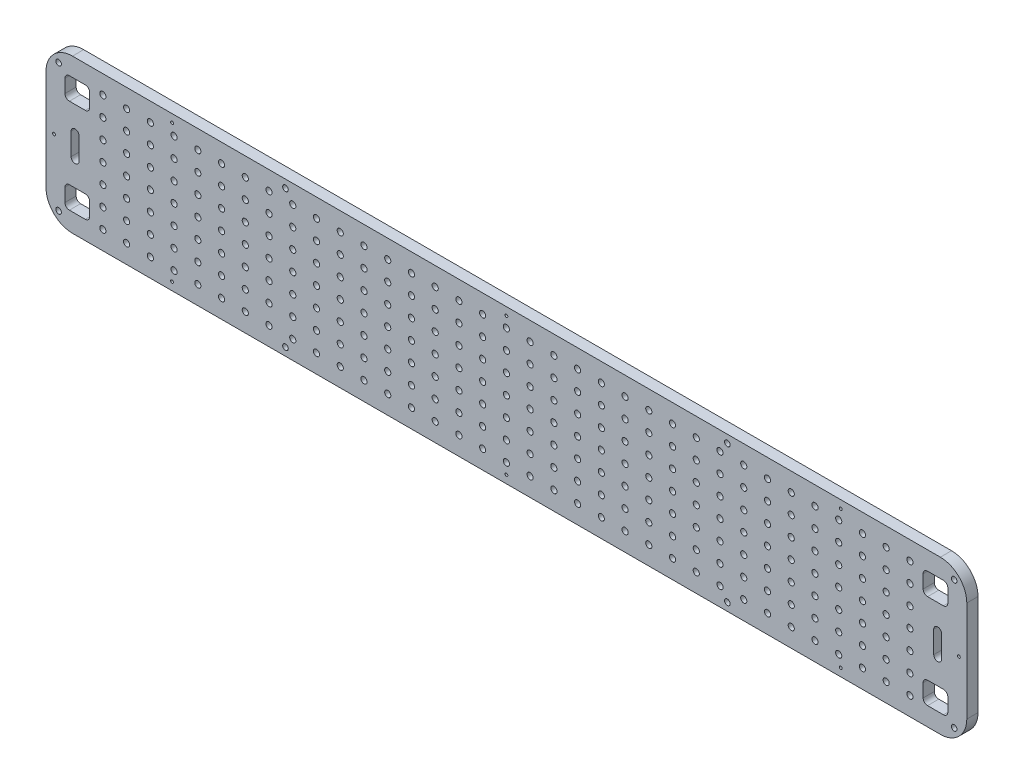
from build123d import *

# Parameters (mm, degrees)
SKETCH1_W                   = 1044
SKETCH1_H                   = 174
BOSS_EXTRUDE1_DEPTH         = 12.7
FILLET1_R                   = 30
SKETCH3_R                   = 3.175
CUT_EXTRUDE1_DEPTH          = 530.352708504
CUT_EXTRUDE2_DEPTH          = 530.352708504
CUT_EXTRUDE2_DEPTH_BACK     = 530.352708504
SKETCH5_W                   = 28
SKETCH5_H                   = 25
FILLET2_R                   = 5
CUT_EXTRUDE3_DEPTH          = 530.352708504
CUT_EXTRUDE3_DEPTH_BACK     = 530.352708504
CUT_EXTRUDE4_DEPTH          = 530.352708504
CUT_EXTRUDE4_DEPTH_BACK     = 530.352708504
SKETCH7_R                   = 1.625
SKETCH8_R                   = 3.5
CUT_EXTRUDE5_DEPTH          = 530.352708504
LPATTERN2_COUNT             = 35
LPATTERN2_PITCH             = 26.911764706
LPATTERN3_COPY_1_SKETCH_R   = 3.5
LPATTERN3_COPY_1_DEPTH      = 530.352708504
LPATTERN3_COPY_2_SKETCH_R   = 3.5
LPATTERN3_COPY_2_DEPTH      = 530.352708504
LPATTERN3_COPY_3_SKETCH_R   = 3.5
LPATTERN3_COPY_3_DEPTH      = 530.352708504
LPATTERN3_COPY_4_SKETCH_R   = 3.5
LPATTERN3_COPY_4_DEPTH      = 530.352708504
LPATTERN3_COPY_5_SKETCH_R   = 3.5
LPATTERN3_COPY_5_DEPTH      = 530.352708504
LPATTERN3_COPY_6_SKETCH_R   = 3.5
LPATTERN3_COPY_6_DEPTH      = 530.352708504
LPATTERN3_COPY_7_SKETCH_R   = 3.5
LPATTERN3_COPY_7_DEPTH      = 530.352708504
LPATTERN3_COPY_8_SKETCH_R   = 3.5
LPATTERN3_COPY_8_DEPTH      = 530.352708504
LPATTERN3_COPY_9_SKETCH_R   = 3.5
LPATTERN3_COPY_9_DEPTH      = 530.352708504
LPATTERN3_COPY_10_SKETCH_R  = 3.5
LPATTERN3_COPY_10_DEPTH     = 530.352708504
LPATTERN3_COPY_11_SKETCH_R  = 3.5
LPATTERN3_COPY_11_DEPTH     = 530.352708504
LPATTERN3_COPY_12_SKETCH_R  = 3.5
LPATTERN3_COPY_12_DEPTH     = 530.352708504
LPATTERN3_COPY_13_SKETCH_R  = 3.5
LPATTERN3_COPY_13_DEPTH     = 530.352708504
LPATTERN3_COPY_14_SKETCH_R  = 3.5
LPATTERN3_COPY_14_DEPTH     = 530.352708504
LPATTERN3_COPY_15_SKETCH_R  = 3.5
LPATTERN3_COPY_15_DEPTH     = 530.352708504
LPATTERN3_COPY_16_SKETCH_R  = 3.5
LPATTERN3_COPY_16_DEPTH     = 530.352708504
LPATTERN3_COPY_17_SKETCH_R  = 3.5
LPATTERN3_COPY_17_DEPTH     = 530.352708504
LPATTERN3_COPY_18_SKETCH_R  = 3.5
LPATTERN3_COPY_18_DEPTH     = 530.352708504
LPATTERN3_COPY_19_SKETCH_R  = 3.5
LPATTERN3_COPY_19_DEPTH     = 530.352708504
LPATTERN3_COPY_20_SKETCH_R  = 3.5
LPATTERN3_COPY_20_DEPTH     = 530.352708504
LPATTERN3_COPY_21_SKETCH_R  = 3.5
LPATTERN3_COPY_21_DEPTH     = 530.352708504
LPATTERN3_COPY_22_SKETCH_R  = 3.5
LPATTERN3_COPY_22_DEPTH     = 530.352708504
LPATTERN3_COPY_23_SKETCH_R  = 3.5
LPATTERN3_COPY_23_DEPTH     = 530.352708504
LPATTERN3_COPY_24_SKETCH_R  = 3.5
LPATTERN3_COPY_24_DEPTH     = 530.352708504
LPATTERN3_COPY_25_SKETCH_R  = 3.5
LPATTERN3_COPY_25_DEPTH     = 530.352708504
LPATTERN3_COPY_26_SKETCH_R  = 3.5
LPATTERN3_COPY_26_DEPTH     = 530.352708504
LPATTERN3_COPY_27_SKETCH_R  = 3.5
LPATTERN3_COPY_27_DEPTH     = 530.352708504
LPATTERN3_COPY_28_SKETCH_R  = 3.5
LPATTERN3_COPY_28_DEPTH     = 530.352708504
LPATTERN3_COPY_29_SKETCH_R  = 3.5
LPATTERN3_COPY_29_DEPTH     = 530.352708504
LPATTERN3_COPY_30_SKETCH_R  = 3.5
LPATTERN3_COPY_30_DEPTH     = 530.352708504
LPATTERN3_COPY_31_SKETCH_R  = 3.5
LPATTERN3_COPY_31_DEPTH     = 530.352708504
LPATTERN3_COPY_32_SKETCH_R  = 3.5
LPATTERN3_COPY_32_DEPTH     = 530.352708504
LPATTERN3_COPY_33_SKETCH_R  = 3.5
LPATTERN3_COPY_33_DEPTH     = 530.352708504
LPATTERN3_COPY_34_SKETCH_R  = 3.5
LPATTERN3_COPY_34_DEPTH     = 530.352708504
LPATTERN3_COPY_35_SKETCH_R  = 3.5
LPATTERN3_COPY_35_DEPTH     = 530.352708504
LPATTERN3_COPY_36_SKETCH_R  = 3.5
LPATTERN3_COPY_36_DEPTH     = 530.352708504
LPATTERN3_COPY_37_SKETCH_R  = 3.5
LPATTERN3_COPY_37_DEPTH     = 530.352708504
LPATTERN3_COPY_38_SKETCH_R  = 3.5
LPATTERN3_COPY_38_DEPTH     = 530.352708504
LPATTERN3_COPY_39_SKETCH_R  = 3.5
LPATTERN3_COPY_39_DEPTH     = 530.352708504
LPATTERN3_COPY_40_SKETCH_R  = 3.5
LPATTERN3_COPY_40_DEPTH     = 530.352708504
LPATTERN3_COPY_41_SKETCH_R  = 3.5
LPATTERN3_COPY_41_DEPTH     = 530.352708504
LPATTERN3_COPY_42_SKETCH_R  = 3.5
LPATTERN3_COPY_42_DEPTH     = 530.352708504
LPATTERN3_COPY_43_SKETCH_R  = 3.5
LPATTERN3_COPY_43_DEPTH     = 530.352708504
LPATTERN3_COPY_44_SKETCH_R  = 3.5
LPATTERN3_COPY_44_DEPTH     = 530.352708504
LPATTERN3_COPY_45_SKETCH_R  = 3.5
LPATTERN3_COPY_45_DEPTH     = 530.352708504
LPATTERN3_COPY_46_SKETCH_R  = 3.5
LPATTERN3_COPY_46_DEPTH     = 530.352708504
LPATTERN3_COPY_47_SKETCH_R  = 3.5
LPATTERN3_COPY_47_DEPTH     = 530.352708504
LPATTERN3_COPY_48_SKETCH_R  = 3.5
LPATTERN3_COPY_48_DEPTH     = 530.352708504
LPATTERN3_COPY_49_SKETCH_R  = 3.5
LPATTERN3_COPY_49_DEPTH     = 530.352708504
LPATTERN3_COPY_50_SKETCH_R  = 3.5
LPATTERN3_COPY_50_DEPTH     = 530.352708504
LPATTERN3_COPY_51_SKETCH_R  = 3.5
LPATTERN3_COPY_51_DEPTH     = 530.352708504
LPATTERN3_COPY_52_SKETCH_R  = 3.5
LPATTERN3_COPY_52_DEPTH     = 530.352708504
LPATTERN3_COPY_53_SKETCH_R  = 3.5
LPATTERN3_COPY_53_DEPTH     = 530.352708504
LPATTERN3_COPY_54_SKETCH_R  = 3.5
LPATTERN3_COPY_54_DEPTH     = 530.352708504
LPATTERN3_COPY_55_SKETCH_R  = 3.5
LPATTERN3_COPY_55_DEPTH     = 530.352708504
LPATTERN3_COPY_56_SKETCH_R  = 3.5
LPATTERN3_COPY_56_DEPTH     = 530.352708504
LPATTERN3_COPY_57_SKETCH_R  = 3.5
LPATTERN3_COPY_57_DEPTH     = 530.352708504
LPATTERN3_COPY_58_SKETCH_R  = 3.5
LPATTERN3_COPY_58_DEPTH     = 530.352708504
LPATTERN3_COPY_59_SKETCH_R  = 3.5
LPATTERN3_COPY_59_DEPTH     = 530.352708504
LPATTERN3_COPY_60_SKETCH_R  = 3.5
LPATTERN3_COPY_60_DEPTH     = 530.352708504
LPATTERN3_COPY_61_SKETCH_R  = 3.5
LPATTERN3_COPY_61_DEPTH     = 530.352708504
LPATTERN3_COPY_62_SKETCH_R  = 3.5
LPATTERN3_COPY_62_DEPTH     = 530.352708504
LPATTERN3_COPY_63_SKETCH_R  = 3.5
LPATTERN3_COPY_63_DEPTH     = 530.352708504
LPATTERN3_COPY_64_SKETCH_R  = 3.5
LPATTERN3_COPY_64_DEPTH     = 530.352708504
LPATTERN3_COPY_65_SKETCH_R  = 3.5
LPATTERN3_COPY_65_DEPTH     = 530.352708504
LPATTERN3_COPY_66_SKETCH_R  = 3.5
LPATTERN3_COPY_66_DEPTH     = 530.352708504
LPATTERN3_COPY_67_SKETCH_R  = 3.5
LPATTERN3_COPY_67_DEPTH     = 530.352708504
LPATTERN3_COPY_68_SKETCH_R  = 3.5
LPATTERN3_COPY_68_DEPTH     = 530.352708504
LPATTERN3_COPY_69_SKETCH_R  = 3.5
LPATTERN3_COPY_69_DEPTH     = 530.352708504
LPATTERN3_COPY_70_SKETCH_R  = 3.5
LPATTERN3_COPY_70_DEPTH     = 530.352708504
LPATTERN3_COPY_71_SKETCH_R  = 3.5
LPATTERN3_COPY_71_DEPTH     = 530.352708504
LPATTERN3_COPY_72_SKETCH_R  = 3.5
LPATTERN3_COPY_72_DEPTH     = 530.352708504
LPATTERN3_COPY_73_SKETCH_R  = 3.5
LPATTERN3_COPY_73_DEPTH     = 530.352708504
LPATTERN3_COPY_74_SKETCH_R  = 3.5
LPATTERN3_COPY_74_DEPTH     = 530.352708504
LPATTERN3_COPY_75_SKETCH_R  = 3.5
LPATTERN3_COPY_75_DEPTH     = 530.352708504
LPATTERN3_COPY_76_SKETCH_R  = 3.5
LPATTERN3_COPY_76_DEPTH     = 530.352708504
LPATTERN3_COPY_77_SKETCH_R  = 3.5
LPATTERN3_COPY_77_DEPTH     = 530.352708504
LPATTERN3_COPY_78_SKETCH_R  = 3.5
LPATTERN3_COPY_78_DEPTH     = 530.352708504
LPATTERN3_COPY_79_SKETCH_R  = 3.5
LPATTERN3_COPY_79_DEPTH     = 530.352708504
LPATTERN3_COPY_80_SKETCH_R  = 3.5
LPATTERN3_COPY_80_DEPTH     = 530.352708504
LPATTERN3_COPY_81_SKETCH_R  = 3.5
LPATTERN3_COPY_81_DEPTH     = 530.352708504
LPATTERN3_COPY_82_SKETCH_R  = 3.5
LPATTERN3_COPY_82_DEPTH     = 530.352708504
LPATTERN3_COPY_83_SKETCH_R  = 3.5
LPATTERN3_COPY_83_DEPTH     = 530.352708504
LPATTERN3_COPY_84_SKETCH_R  = 3.5
LPATTERN3_COPY_84_DEPTH     = 530.352708504
LPATTERN3_COPY_85_SKETCH_R  = 3.5
LPATTERN3_COPY_85_DEPTH     = 530.352708504
LPATTERN3_COPY_86_SKETCH_R  = 3.5
LPATTERN3_COPY_86_DEPTH     = 530.352708504
LPATTERN3_COPY_87_SKETCH_R  = 3.5
LPATTERN3_COPY_87_DEPTH     = 530.352708504
LPATTERN3_COPY_88_SKETCH_R  = 3.5
LPATTERN3_COPY_88_DEPTH     = 530.352708504
LPATTERN3_COPY_89_SKETCH_R  = 3.5
LPATTERN3_COPY_89_DEPTH     = 530.352708504
LPATTERN3_COPY_90_SKETCH_R  = 3.5
LPATTERN3_COPY_90_DEPTH     = 530.352708504
LPATTERN3_COPY_91_SKETCH_R  = 3.5
LPATTERN3_COPY_91_DEPTH     = 530.352708504
LPATTERN3_COPY_92_SKETCH_R  = 3.5
LPATTERN3_COPY_92_DEPTH     = 530.352708504
LPATTERN3_COPY_93_SKETCH_R  = 3.5
LPATTERN3_COPY_93_DEPTH     = 530.352708504
LPATTERN3_COPY_94_SKETCH_R  = 3.5
LPATTERN3_COPY_94_DEPTH     = 530.352708504
LPATTERN3_COPY_95_SKETCH_R  = 3.5
LPATTERN3_COPY_95_DEPTH     = 530.352708504
LPATTERN3_COPY_96_SKETCH_R  = 3.5
LPATTERN3_COPY_96_DEPTH     = 530.352708504
LPATTERN3_COPY_97_SKETCH_R  = 3.5
LPATTERN3_COPY_97_DEPTH     = 530.352708504
LPATTERN3_COPY_98_SKETCH_R  = 3.5
LPATTERN3_COPY_98_DEPTH     = 530.352708504
LPATTERN3_COPY_99_SKETCH_R  = 3.5
LPATTERN3_COPY_99_DEPTH     = 530.352708504
LPATTERN3_COPY_100_SKETCH_R = 3.5
LPATTERN3_COPY_100_DEPTH    = 530.352708504
LPATTERN3_COPY_101_SKETCH_R = 3.5
LPATTERN3_COPY_101_DEPTH    = 530.352708504
LPATTERN3_COPY_102_SKETCH_R = 3.5
LPATTERN3_COPY_102_DEPTH    = 530.352708504
LPATTERN3_COPY_103_SKETCH_R = 3.5
LPATTERN3_COPY_103_DEPTH    = 530.352708504
LPATTERN3_COPY_104_SKETCH_R = 3.5
LPATTERN3_COPY_104_DEPTH    = 530.352708504
LPATTERN3_COPY_105_SKETCH_R = 3.5
LPATTERN3_COPY_105_DEPTH    = 530.352708504
LPATTERN3_COPY_106_SKETCH_R = 3.5
LPATTERN3_COPY_106_DEPTH    = 530.352708504
LPATTERN3_COPY_107_SKETCH_R = 3.5
LPATTERN3_COPY_107_DEPTH    = 530.352708504
LPATTERN3_COPY_108_SKETCH_R = 3.5
LPATTERN3_COPY_108_DEPTH    = 530.352708504
LPATTERN3_COPY_109_SKETCH_R = 3.5
LPATTERN3_COPY_109_DEPTH    = 530.352708504
LPATTERN3_COPY_110_SKETCH_R = 3.5
LPATTERN3_COPY_110_DEPTH    = 530.352708504
LPATTERN3_COPY_111_SKETCH_R = 3.5
LPATTERN3_COPY_111_DEPTH    = 530.352708504
LPATTERN3_COPY_112_SKETCH_R = 3.5
LPATTERN3_COPY_112_DEPTH    = 530.352708504
LPATTERN3_COPY_113_SKETCH_R = 3.5
LPATTERN3_COPY_113_DEPTH    = 530.352708504
LPATTERN3_COPY_114_SKETCH_R = 3.5
LPATTERN3_COPY_114_DEPTH    = 530.352708504
LPATTERN3_COPY_115_SKETCH_R = 3.5
LPATTERN3_COPY_115_DEPTH    = 530.352708504
LPATTERN3_COPY_116_SKETCH_R = 3.5
LPATTERN3_COPY_116_DEPTH    = 530.352708504
LPATTERN3_COPY_117_SKETCH_R = 3.5
LPATTERN3_COPY_117_DEPTH    = 530.352708504
LPATTERN3_COPY_118_SKETCH_R = 3.5
LPATTERN3_COPY_118_DEPTH    = 530.352708504
LPATTERN3_COPY_119_SKETCH_R = 3.5
LPATTERN3_COPY_119_DEPTH    = 530.352708504
LPATTERN3_COPY_120_SKETCH_R = 3.5
LPATTERN3_COPY_120_DEPTH    = 530.352708504
LPATTERN3_COPY_121_SKETCH_R = 3.5
LPATTERN3_COPY_121_DEPTH    = 530.352708504
LPATTERN3_COPY_122_SKETCH_R = 3.5
LPATTERN3_COPY_122_DEPTH    = 530.352708504
LPATTERN3_COPY_123_SKETCH_R = 3.5
LPATTERN3_COPY_123_DEPTH    = 530.352708504
LPATTERN3_COPY_124_SKETCH_R = 3.5
LPATTERN3_COPY_124_DEPTH    = 530.352708504
LPATTERN3_COPY_125_SKETCH_R = 3.5
LPATTERN3_COPY_125_DEPTH    = 530.352708504
LPATTERN3_COPY_126_SKETCH_R = 3.5
LPATTERN3_COPY_126_DEPTH    = 530.352708504
LPATTERN3_COPY_127_SKETCH_R = 3.5
LPATTERN3_COPY_127_DEPTH    = 530.352708504
LPATTERN3_COPY_128_SKETCH_R = 3.5
LPATTERN3_COPY_128_DEPTH    = 530.352708504
LPATTERN3_COPY_129_SKETCH_R = 3.5
LPATTERN3_COPY_129_DEPTH    = 530.352708504
LPATTERN3_COPY_130_SKETCH_R = 3.5
LPATTERN3_COPY_130_DEPTH    = 530.352708504
LPATTERN3_COPY_131_SKETCH_R = 3.5
LPATTERN3_COPY_131_DEPTH    = 530.352708504
LPATTERN3_COPY_132_SKETCH_R = 3.5
LPATTERN3_COPY_132_DEPTH    = 530.352708504
LPATTERN3_COPY_133_SKETCH_R = 3.5
LPATTERN3_COPY_133_DEPTH    = 530.352708504
LPATTERN3_COPY_134_SKETCH_R = 3.5
LPATTERN3_COPY_134_DEPTH    = 530.352708504
LPATTERN3_COPY_135_SKETCH_R = 3.5
LPATTERN3_COPY_135_DEPTH    = 530.352708504
LPATTERN3_COPY_136_SKETCH_R = 3.5
LPATTERN3_COPY_136_DEPTH    = 530.352708504
LPATTERN3_COPY_137_SKETCH_R = 3.5
LPATTERN3_COPY_137_DEPTH    = 530.352708504
LPATTERN3_COPY_138_SKETCH_R = 3.5
LPATTERN3_COPY_138_DEPTH    = 530.352708504
LPATTERN3_COPY_139_SKETCH_R = 3.5
LPATTERN3_COPY_139_DEPTH    = 530.352708504
LPATTERN3_COPY_140_SKETCH_R = 3.5
LPATTERN3_COPY_140_DEPTH    = 530.352708504
LPATTERN3_COPY_141_SKETCH_R = 3.5
LPATTERN3_COPY_141_DEPTH    = 530.352708504
LPATTERN3_COPY_142_SKETCH_R = 3.5
LPATTERN3_COPY_142_DEPTH    = 530.352708504
LPATTERN3_COPY_143_SKETCH_R = 3.5
LPATTERN3_COPY_143_DEPTH    = 530.352708504
LPATTERN3_COPY_144_SKETCH_R = 3.5
LPATTERN3_COPY_144_DEPTH    = 530.352708504
LPATTERN3_COPY_145_SKETCH_R = 3.5
LPATTERN3_COPY_145_DEPTH    = 530.352708504
LPATTERN3_COPY_146_SKETCH_R = 3.5
LPATTERN3_COPY_146_DEPTH    = 530.352708504
LPATTERN3_COPY_147_SKETCH_R = 3.5
LPATTERN3_COPY_147_DEPTH    = 530.352708504
LPATTERN3_COPY_148_SKETCH_R = 3.5
LPATTERN3_COPY_148_DEPTH    = 530.352708504
LPATTERN3_COPY_149_SKETCH_R = 3.5
LPATTERN3_COPY_149_DEPTH    = 530.352708504
LPATTERN3_COPY_150_SKETCH_R = 3.5
LPATTERN3_COPY_150_DEPTH    = 530.352708504
LPATTERN3_COPY_151_SKETCH_R = 3.5
LPATTERN3_COPY_151_DEPTH    = 530.352708504
LPATTERN3_COPY_152_SKETCH_R = 3.5
LPATTERN3_COPY_152_DEPTH    = 530.352708504
LPATTERN3_COPY_153_SKETCH_R = 3.5
LPATTERN3_COPY_153_DEPTH    = 530.352708504
LPATTERN3_COPY_154_SKETCH_R = 3.5
LPATTERN3_COPY_154_DEPTH    = 530.352708504
LPATTERN3_COPY_155_SKETCH_R = 3.5
LPATTERN3_COPY_155_DEPTH    = 530.352708504
LPATTERN3_COPY_156_SKETCH_R = 3.5
LPATTERN3_COPY_156_DEPTH    = 530.352708504
LPATTERN3_COPY_157_SKETCH_R = 3.5
LPATTERN3_COPY_157_DEPTH    = 530.352708504
LPATTERN3_COPY_158_SKETCH_R = 3.5
LPATTERN3_COPY_158_DEPTH    = 530.352708504
LPATTERN3_COPY_159_SKETCH_R = 3.5
LPATTERN3_COPY_159_DEPTH    = 530.352708504
LPATTERN3_COPY_160_SKETCH_R = 3.5
LPATTERN3_COPY_160_DEPTH    = 530.352708504
LPATTERN3_COPY_161_SKETCH_R = 3.5
LPATTERN3_COPY_161_DEPTH    = 530.352708504
LPATTERN3_COPY_162_SKETCH_R = 3.5
LPATTERN3_COPY_162_DEPTH    = 530.352708504
LPATTERN3_COPY_163_SKETCH_R = 3.5
LPATTERN3_COPY_163_DEPTH    = 530.352708504
LPATTERN3_COPY_164_SKETCH_R = 3.5
LPATTERN3_COPY_164_DEPTH    = 530.352708504
LPATTERN3_COPY_165_SKETCH_R = 3.5
LPATTERN3_COPY_165_DEPTH    = 530.352708504
LPATTERN3_COPY_166_SKETCH_R = 3.5
LPATTERN3_COPY_166_DEPTH    = 530.352708504
LPATTERN3_COPY_167_SKETCH_R = 3.5
LPATTERN3_COPY_167_DEPTH    = 530.352708504
LPATTERN3_COPY_168_SKETCH_R = 3.5
LPATTERN3_COPY_168_DEPTH    = 530.352708504
LPATTERN3_COPY_169_SKETCH_R = 3.5
LPATTERN3_COPY_169_DEPTH    = 530.352708504
LPATTERN3_COPY_170_SKETCH_R = 3.5
LPATTERN3_COPY_170_DEPTH    = 530.352708504
LPATTERN3_COPY_171_SKETCH_R = 3.5
LPATTERN3_COPY_171_DEPTH    = 530.352708504
LPATTERN3_COPY_172_SKETCH_R = 3.5
LPATTERN3_COPY_172_DEPTH    = 530.352708504
LPATTERN3_COPY_173_SKETCH_R = 3.5
LPATTERN3_COPY_173_DEPTH    = 530.352708504
LPATTERN3_COPY_174_SKETCH_R = 3.5
LPATTERN3_COPY_174_DEPTH    = 530.352708504
LPATTERN3_COPY_175_SKETCH_R = 3.5
LPATTERN3_COPY_175_DEPTH    = 530.352708504
LPATTERN3_COPY_176_SKETCH_R = 3.5
LPATTERN3_COPY_176_DEPTH    = 530.352708504
LPATTERN3_COPY_177_SKETCH_R = 3.5
LPATTERN3_COPY_177_DEPTH    = 530.352708504
LPATTERN3_COPY_178_SKETCH_R = 3.5
LPATTERN3_COPY_178_DEPTH    = 530.352708504
LPATTERN3_COPY_179_SKETCH_R = 3.5
LPATTERN3_COPY_179_DEPTH    = 530.352708504
LPATTERN3_COPY_180_SKETCH_R = 3.5
LPATTERN3_COPY_180_DEPTH    = 530.352708504
LPATTERN3_COPY_181_SKETCH_R = 3.5
LPATTERN3_COPY_181_DEPTH    = 530.352708504
LPATTERN3_COPY_182_SKETCH_R = 3.5
LPATTERN3_COPY_182_DEPTH    = 530.352708504
LPATTERN3_COPY_183_SKETCH_R = 3.5
LPATTERN3_COPY_183_DEPTH    = 530.352708504
LPATTERN3_COPY_184_SKETCH_R = 3.5
LPATTERN3_COPY_184_DEPTH    = 530.352708504
LPATTERN3_COPY_185_SKETCH_R = 3.5
LPATTERN3_COPY_185_DEPTH    = 530.352708504
LPATTERN3_COPY_186_SKETCH_R = 3.5
LPATTERN3_COPY_186_DEPTH    = 530.352708504
LPATTERN3_COPY_187_SKETCH_R = 3.5
LPATTERN3_COPY_187_DEPTH    = 530.352708504
LPATTERN3_COPY_188_SKETCH_R = 3.5
LPATTERN3_COPY_188_DEPTH    = 530.352708504
LPATTERN3_COPY_189_SKETCH_R = 3.5
LPATTERN3_COPY_189_DEPTH    = 530.352708504
LPATTERN3_COPY_190_SKETCH_R = 3.5
LPATTERN3_COPY_190_DEPTH    = 530.352708504
LPATTERN3_COPY_191_SKETCH_R = 3.5
LPATTERN3_COPY_191_DEPTH    = 530.352708504
LPATTERN3_COPY_192_SKETCH_R = 3.5
LPATTERN3_COPY_192_DEPTH    = 530.352708504
LPATTERN3_COPY_193_SKETCH_R = 3.5
LPATTERN3_COPY_193_DEPTH    = 530.352708504
LPATTERN3_COPY_194_SKETCH_R = 3.5
LPATTERN3_COPY_194_DEPTH    = 530.352708504
LPATTERN3_COPY_195_SKETCH_R = 3.5
LPATTERN3_COPY_195_DEPTH    = 530.352708504
LPATTERN3_COPY_196_SKETCH_R = 3.5
LPATTERN3_COPY_196_DEPTH    = 530.352708504
LPATTERN3_COPY_197_SKETCH_R = 3.5
LPATTERN3_COPY_197_DEPTH    = 530.352708504
LPATTERN3_COPY_198_SKETCH_R = 3.5
LPATTERN3_COPY_198_DEPTH    = 530.352708504
LPATTERN3_COPY_199_SKETCH_R = 3.5
LPATTERN3_COPY_199_DEPTH    = 530.352708504
LPATTERN3_COPY_200_SKETCH_R = 3.5
LPATTERN3_COPY_200_DEPTH    = 530.352708504
LPATTERN3_COPY_201_SKETCH_R = 3.5
LPATTERN3_COPY_201_DEPTH    = 530.352708504
LPATTERN3_COPY_202_SKETCH_R = 3.5
LPATTERN3_COPY_202_DEPTH    = 530.352708504
LPATTERN3_COPY_203_SKETCH_R = 3.5
LPATTERN3_COPY_203_DEPTH    = 530.352708504
LPATTERN3_COPY_204_SKETCH_R = 3.5
LPATTERN3_COPY_204_DEPTH    = 530.352708504
LPATTERN3_COPY_205_SKETCH_R = 3.5
LPATTERN3_COPY_205_DEPTH    = 530.352708504
LPATTERN3_COPY_206_SKETCH_R = 3.5
LPATTERN3_COPY_206_DEPTH    = 530.352708504
LPATTERN3_COPY_207_SKETCH_R = 3.5
LPATTERN3_COPY_207_DEPTH    = 530.352708504
LPATTERN3_COPY_208_SKETCH_R = 3.5
LPATTERN3_COPY_208_DEPTH    = 530.352708504
LPATTERN3_COPY_209_SKETCH_R = 3.5
LPATTERN3_COPY_209_DEPTH    = 530.352708504
LPATTERN3_COPY_210_SKETCH_R = 3.5
LPATTERN3_COPY_210_DEPTH    = 530.352708504


with BuildPart() as part:
    # Sketch1 → Boss-Extrude1 (new body)
    with BuildSketch(Plane.XY):
        Rectangle(SKETCH1_W, SKETCH1_H)
    extrude(amount=BOSS_EXTRUDE1_DEPTH)

    # Fillet1
    fillet1_edges = [part.edges().sort_by_distance(p)[0] for p in [
        (522, -87, 6.35),
        (522, 87, 6.35),
        (-522, -87, 6.35),
        (-522, 87, 6.35),
    ]]
    fillet(fillet1_edges, radius=FILLET1_R)

    # Sketch3 → Cut-Extrude1 (cut, through all)
    with BuildSketch(Plane.XY.offset(12.7)):
        with Locations((-507.727922061, 72.727922061)):
            Circle(SKETCH3_R)
        with Locations((-250.5, 78)):
            Circle(SKETCH3_R)
        with Locations((250.5, 78)):
            Circle(SKETCH3_R)
        with Locations((507.727922061, 72.727922061)):
            Circle(SKETCH3_R)
        with Locations((507.727922061, -72.727922061)):
            Circle(SKETCH3_R)
        with Locations((250.5, -78)):
            Circle(SKETCH3_R)
        with Locations((-250.5, -78)):
            Circle(SKETCH3_R)
        with Locations((-507.727922061, -72.727922061)):
            Circle(SKETCH3_R)
    extrude(amount=-CUT_EXTRUDE1_DEPTH, mode=Mode.SUBTRACT)

    # Sketch5 → Cut-Extrude2 (cut, two sides: drawn at the far end of the back side and taken through both)
    with BuildSketch(Plane.XY.offset(12.7).offset(-CUT_EXTRUDE2_DEPTH_BACK)):
        with Locations((-486.5, 53.5)):
            Rectangle(SKETCH5_W, SKETCH5_H)
        with Locations((-486.5, -53.5)):
            Rectangle(SKETCH5_W, SKETCH5_H)
        with Locations((486.5, 53.5)):
            Rectangle(SKETCH5_W, SKETCH5_H)
        with Locations((486.5, -53.5)):
            Rectangle(SKETCH5_W, SKETCH5_H)
    extrude(amount=CUT_EXTRUDE2_DEPTH + CUT_EXTRUDE2_DEPTH_BACK, mode=Mode.SUBTRACT)

    # Fillet2
    fillet2_edges = [part.edges().sort_by_distance(p)[0] for p in [
        (-500.5, 66, 6.35),
        (-472.5, 66, 6.35),
        (-472.5, 41, 6.35),
        (-500.5, 41, 6.35),
        (-500.5, -41, 6.35),
        (-472.5, -41, 6.35),
        (-500.5, -66, 6.35),
        (-472.5, -66, 6.35),
        (500.5, 66, 6.35),
        (472.5, 66, 6.35),
        (472.5, 41, 6.35),
        (500.5, 41, 6.35),
        (500.5, -66, 6.35),
        (472.5, -66, 6.35),
        (472.5, -41, 6.35),
        (500.5, -41, 6.35),
    ]]
    fillet(fillet2_edges, radius=FILLET2_R)

    # Sketch6 → Cut-Extrude3 (cut, two sides: drawn at the far end of the back side and taken through both)
    with BuildSketch(Plane.XY.offset(12.7).offset(-CUT_EXTRUDE3_DEPTH_BACK)):
        with BuildLine():
            Line((493.5, 12.5), (493.5, -12.5))
            ThreePointArc((493.5, -12.5), (489, -17), (484.5, -12.5))
            Line((484.5, -12.5), (484.5, 12.5))
            ThreePointArc((484.5, 12.5), (489, 17), (493.5, 12.5))
        make_face()
        with BuildLine():
            Line((-493.5, -12.5), (-493.5, 12.5))
            ThreePointArc((-493.5, 12.5), (-489, 17), (-484.5, 12.5))
            Line((-484.5, 12.5), (-484.5, -12.5))
            ThreePointArc((-484.5, -12.5), (-489, -17), (-493.5, -12.5))
        make_face()
    extrude(amount=CUT_EXTRUDE3_DEPTH + CUT_EXTRUDE3_DEPTH_BACK, mode=Mode.SUBTRACT)

    # Sketch7 → Cut-Extrude4 (cut, two sides: drawn at the far end of the back side and taken through both)
    with BuildSketch(Plane.XY.offset(12.7).offset(-CUT_EXTRUDE4_DEPTH_BACK)):
        with Locations((-513, 0)):
            Circle(SKETCH7_R)
        with Locations((-379.113961031, -78)):
            Circle(SKETCH7_R)
        with Locations((0, -78)):
            Circle(SKETCH7_R)
        with Locations((379.113961031, -78)):
            Circle(SKETCH7_R)
        with Locations((513, 0)):
            Circle(SKETCH7_R)
        with Locations((379.113961031, 78)):
            Circle(SKETCH7_R)
        with Locations((0, 78)):
            Circle(SKETCH7_R)
        with Locations((-379.113961031, 78)):
            Circle(SKETCH7_R)
    extrude(amount=CUT_EXTRUDE4_DEPTH + CUT_EXTRUDE4_DEPTH_BACK, mode=Mode.SUBTRACT)

    # Sketch8 → Cut-Extrude5 (cut, symmetric)
    with BuildSketch(Plane.XY.offset(12.7)):
        with Locations((-457.5, 66)):
            Circle(SKETCH8_R)
    cut_extrude5 = extrude(amount=CUT_EXTRUDE5_DEPTH, both=True, mode=Mode.SUBTRACT)

    # LPattern2: Cut-Extrude5 ×35
    with Locations(*[(i * LPATTERN2_PITCH, 0, 0) for i in range(1, LPATTERN2_COUNT)]):
        add(cut_extrude5, mode=Mode.SUBTRACT)

    # LPattern3 copy 1 sketch → LPattern3 copy 1 (cut, symmetric)
    with BuildSketch(Plane(origin=(26.911764706, -22, 12.7), x_dir=(1, 0, 0), z_dir=(0, 0, 1))):
        with Locations((-457.5, 66)):
            Circle(LPATTERN3_COPY_1_SKETCH_R)
    extrude(amount=LPATTERN3_COPY_1_DEPTH, both=True, mode=Mode.SUBTRACT)

    # LPattern3 copy 2 sketch → LPattern3 copy 2 (cut, symmetric)
    with BuildSketch(Plane(origin=(26.911764706, -44, 12.7), x_dir=(1, 0, 0), z_dir=(0, 0, 1))):
        with Locations((-457.5, 66)):
            Circle(LPATTERN3_COPY_2_SKETCH_R)
    extrude(amount=LPATTERN3_COPY_2_DEPTH, both=True, mode=Mode.SUBTRACT)

    # LPattern3 copy 3 sketch → LPattern3 copy 3 (cut, symmetric)
    with BuildSketch(Plane(origin=(26.911764706, -66, 12.7), x_dir=(1, 0, 0), z_dir=(0, 0, 1))):
        with Locations((-457.5, 66)):
            Circle(LPATTERN3_COPY_3_SKETCH_R)
    extrude(amount=LPATTERN3_COPY_3_DEPTH, both=True, mode=Mode.SUBTRACT)

    # LPattern3 copy 4 sketch → LPattern3 copy 4 (cut, symmetric)
    with BuildSketch(Plane(origin=(26.911764706, -88, 12.7), x_dir=(1, 0, 0), z_dir=(0, 0, 1))):
        with Locations((-457.5, 66)):
            Circle(LPATTERN3_COPY_4_SKETCH_R)
    extrude(amount=LPATTERN3_COPY_4_DEPTH, both=True, mode=Mode.SUBTRACT)

    # LPattern3 copy 5 sketch → LPattern3 copy 5 (cut, symmetric)
    with BuildSketch(Plane(origin=(26.911764706, -110, 12.7), x_dir=(1, 0, 0), z_dir=(0, 0, 1))):
        with Locations((-457.5, 66)):
            Circle(LPATTERN3_COPY_5_SKETCH_R)
    extrude(amount=LPATTERN3_COPY_5_DEPTH, both=True, mode=Mode.SUBTRACT)

    # LPattern3 copy 6 sketch → LPattern3 copy 6 (cut, symmetric)
    with BuildSketch(Plane(origin=(26.911764706, -132, 12.7), x_dir=(1, 0, 0), z_dir=(0, 0, 1))):
        with Locations((-457.5, 66)):
            Circle(LPATTERN3_COPY_6_SKETCH_R)
    extrude(amount=LPATTERN3_COPY_6_DEPTH, both=True, mode=Mode.SUBTRACT)

    # LPattern3 copy 7 sketch → LPattern3 copy 7 (cut, symmetric)
    with BuildSketch(Plane(origin=(53.823529412, -22, 12.7), x_dir=(1, 0, 0), z_dir=(0, 0, 1))):
        with Locations((-457.5, 66)):
            Circle(LPATTERN3_COPY_7_SKETCH_R)
    extrude(amount=LPATTERN3_COPY_7_DEPTH, both=True, mode=Mode.SUBTRACT)

    # LPattern3 copy 8 sketch → LPattern3 copy 8 (cut, symmetric)
    with BuildSketch(Plane(origin=(53.823529412, -44, 12.7), x_dir=(1, 0, 0), z_dir=(0, 0, 1))):
        with Locations((-457.5, 66)):
            Circle(LPATTERN3_COPY_8_SKETCH_R)
    extrude(amount=LPATTERN3_COPY_8_DEPTH, both=True, mode=Mode.SUBTRACT)

    # LPattern3 copy 9 sketch → LPattern3 copy 9 (cut, symmetric)
    with BuildSketch(Plane(origin=(53.823529412, -66, 12.7), x_dir=(1, 0, 0), z_dir=(0, 0, 1))):
        with Locations((-457.5, 66)):
            Circle(LPATTERN3_COPY_9_SKETCH_R)
    extrude(amount=LPATTERN3_COPY_9_DEPTH, both=True, mode=Mode.SUBTRACT)

    # LPattern3 copy 10 sketch → LPattern3 copy 10 (cut, symmetric)
    with BuildSketch(Plane(origin=(53.823529412, -88, 12.7), x_dir=(1, 0, 0), z_dir=(0, 0, 1))):
        with Locations((-457.5, 66)):
            Circle(LPATTERN3_COPY_10_SKETCH_R)
    extrude(amount=LPATTERN3_COPY_10_DEPTH, both=True, mode=Mode.SUBTRACT)

    # LPattern3 copy 11 sketch → LPattern3 copy 11 (cut, symmetric)
    with BuildSketch(Plane(origin=(53.823529412, -110, 12.7), x_dir=(1, 0, 0), z_dir=(0, 0, 1))):
        with Locations((-457.5, 66)):
            Circle(LPATTERN3_COPY_11_SKETCH_R)
    extrude(amount=LPATTERN3_COPY_11_DEPTH, both=True, mode=Mode.SUBTRACT)

    # LPattern3 copy 12 sketch → LPattern3 copy 12 (cut, symmetric)
    with BuildSketch(Plane(origin=(53.823529412, -132, 12.7), x_dir=(1, 0, 0), z_dir=(0, 0, 1))):
        with Locations((-457.5, 66)):
            Circle(LPATTERN3_COPY_12_SKETCH_R)
    extrude(amount=LPATTERN3_COPY_12_DEPTH, both=True, mode=Mode.SUBTRACT)

    # LPattern3 copy 13 sketch → LPattern3 copy 13 (cut, symmetric)
    with BuildSketch(Plane(origin=(80.735294118, -22, 12.7), x_dir=(1, 0, 0), z_dir=(0, 0, 1))):
        with Locations((-457.5, 66)):
            Circle(LPATTERN3_COPY_13_SKETCH_R)
    extrude(amount=LPATTERN3_COPY_13_DEPTH, both=True, mode=Mode.SUBTRACT)

    # LPattern3 copy 14 sketch → LPattern3 copy 14 (cut, symmetric)
    with BuildSketch(Plane(origin=(80.735294118, -44, 12.7), x_dir=(1, 0, 0), z_dir=(0, 0, 1))):
        with Locations((-457.5, 66)):
            Circle(LPATTERN3_COPY_14_SKETCH_R)
    extrude(amount=LPATTERN3_COPY_14_DEPTH, both=True, mode=Mode.SUBTRACT)

    # LPattern3 copy 15 sketch → LPattern3 copy 15 (cut, symmetric)
    with BuildSketch(Plane(origin=(80.735294118, -66, 12.7), x_dir=(1, 0, 0), z_dir=(0, 0, 1))):
        with Locations((-457.5, 66)):
            Circle(LPATTERN3_COPY_15_SKETCH_R)
    extrude(amount=LPATTERN3_COPY_15_DEPTH, both=True, mode=Mode.SUBTRACT)

    # LPattern3 copy 16 sketch → LPattern3 copy 16 (cut, symmetric)
    with BuildSketch(Plane(origin=(80.735294118, -88, 12.7), x_dir=(1, 0, 0), z_dir=(0, 0, 1))):
        with Locations((-457.5, 66)):
            Circle(LPATTERN3_COPY_16_SKETCH_R)
    extrude(amount=LPATTERN3_COPY_16_DEPTH, both=True, mode=Mode.SUBTRACT)

    # LPattern3 copy 17 sketch → LPattern3 copy 17 (cut, symmetric)
    with BuildSketch(Plane(origin=(80.735294118, -110, 12.7), x_dir=(1, 0, 0), z_dir=(0, 0, 1))):
        with Locations((-457.5, 66)):
            Circle(LPATTERN3_COPY_17_SKETCH_R)
    extrude(amount=LPATTERN3_COPY_17_DEPTH, both=True, mode=Mode.SUBTRACT)

    # LPattern3 copy 18 sketch → LPattern3 copy 18 (cut, symmetric)
    with BuildSketch(Plane(origin=(80.735294118, -132, 12.7), x_dir=(1, 0, 0), z_dir=(0, 0, 1))):
        with Locations((-457.5, 66)):
            Circle(LPATTERN3_COPY_18_SKETCH_R)
    extrude(amount=LPATTERN3_COPY_18_DEPTH, both=True, mode=Mode.SUBTRACT)

    # LPattern3 copy 19 sketch → LPattern3 copy 19 (cut, symmetric)
    with BuildSketch(Plane(origin=(107.647058824, -22, 12.7), x_dir=(1, 0, 0), z_dir=(0, 0, 1))):
        with Locations((-457.5, 66)):
            Circle(LPATTERN3_COPY_19_SKETCH_R)
    extrude(amount=LPATTERN3_COPY_19_DEPTH, both=True, mode=Mode.SUBTRACT)

    # LPattern3 copy 20 sketch → LPattern3 copy 20 (cut, symmetric)
    with BuildSketch(Plane(origin=(107.647058824, -44, 12.7), x_dir=(1, 0, 0), z_dir=(0, 0, 1))):
        with Locations((-457.5, 66)):
            Circle(LPATTERN3_COPY_20_SKETCH_R)
    extrude(amount=LPATTERN3_COPY_20_DEPTH, both=True, mode=Mode.SUBTRACT)

    # LPattern3 copy 21 sketch → LPattern3 copy 21 (cut, symmetric)
    with BuildSketch(Plane(origin=(107.647058824, -66, 12.7), x_dir=(1, 0, 0), z_dir=(0, 0, 1))):
        with Locations((-457.5, 66)):
            Circle(LPATTERN3_COPY_21_SKETCH_R)
    extrude(amount=LPATTERN3_COPY_21_DEPTH, both=True, mode=Mode.SUBTRACT)

    # LPattern3 copy 22 sketch → LPattern3 copy 22 (cut, symmetric)
    with BuildSketch(Plane(origin=(107.647058824, -88, 12.7), x_dir=(1, 0, 0), z_dir=(0, 0, 1))):
        with Locations((-457.5, 66)):
            Circle(LPATTERN3_COPY_22_SKETCH_R)
    extrude(amount=LPATTERN3_COPY_22_DEPTH, both=True, mode=Mode.SUBTRACT)

    # LPattern3 copy 23 sketch → LPattern3 copy 23 (cut, symmetric)
    with BuildSketch(Plane(origin=(107.647058824, -110, 12.7), x_dir=(1, 0, 0), z_dir=(0, 0, 1))):
        with Locations((-457.5, 66)):
            Circle(LPATTERN3_COPY_23_SKETCH_R)
    extrude(amount=LPATTERN3_COPY_23_DEPTH, both=True, mode=Mode.SUBTRACT)

    # LPattern3 copy 24 sketch → LPattern3 copy 24 (cut, symmetric)
    with BuildSketch(Plane(origin=(107.647058824, -132, 12.7), x_dir=(1, 0, 0), z_dir=(0, 0, 1))):
        with Locations((-457.5, 66)):
            Circle(LPATTERN3_COPY_24_SKETCH_R)
    extrude(amount=LPATTERN3_COPY_24_DEPTH, both=True, mode=Mode.SUBTRACT)

    # LPattern3 copy 25 sketch → LPattern3 copy 25 (cut, symmetric)
    with BuildSketch(Plane(origin=(134.558823529, -22, 12.7), x_dir=(1, 0, 0), z_dir=(0, 0, 1))):
        with Locations((-457.5, 66)):
            Circle(LPATTERN3_COPY_25_SKETCH_R)
    extrude(amount=LPATTERN3_COPY_25_DEPTH, both=True, mode=Mode.SUBTRACT)

    # LPattern3 copy 26 sketch → LPattern3 copy 26 (cut, symmetric)
    with BuildSketch(Plane(origin=(134.558823529, -44, 12.7), x_dir=(1, 0, 0), z_dir=(0, 0, 1))):
        with Locations((-457.5, 66)):
            Circle(LPATTERN3_COPY_26_SKETCH_R)
    extrude(amount=LPATTERN3_COPY_26_DEPTH, both=True, mode=Mode.SUBTRACT)

    # LPattern3 copy 27 sketch → LPattern3 copy 27 (cut, symmetric)
    with BuildSketch(Plane(origin=(134.558823529, -66, 12.7), x_dir=(1, 0, 0), z_dir=(0, 0, 1))):
        with Locations((-457.5, 66)):
            Circle(LPATTERN3_COPY_27_SKETCH_R)
    extrude(amount=LPATTERN3_COPY_27_DEPTH, both=True, mode=Mode.SUBTRACT)

    # LPattern3 copy 28 sketch → LPattern3 copy 28 (cut, symmetric)
    with BuildSketch(Plane(origin=(134.558823529, -88, 12.7), x_dir=(1, 0, 0), z_dir=(0, 0, 1))):
        with Locations((-457.5, 66)):
            Circle(LPATTERN3_COPY_28_SKETCH_R)
    extrude(amount=LPATTERN3_COPY_28_DEPTH, both=True, mode=Mode.SUBTRACT)

    # LPattern3 copy 29 sketch → LPattern3 copy 29 (cut, symmetric)
    with BuildSketch(Plane(origin=(134.558823529, -110, 12.7), x_dir=(1, 0, 0), z_dir=(0, 0, 1))):
        with Locations((-457.5, 66)):
            Circle(LPATTERN3_COPY_29_SKETCH_R)
    extrude(amount=LPATTERN3_COPY_29_DEPTH, both=True, mode=Mode.SUBTRACT)

    # LPattern3 copy 30 sketch → LPattern3 copy 30 (cut, symmetric)
    with BuildSketch(Plane(origin=(134.558823529, -132, 12.7), x_dir=(1, 0, 0), z_dir=(0, 0, 1))):
        with Locations((-457.5, 66)):
            Circle(LPATTERN3_COPY_30_SKETCH_R)
    extrude(amount=LPATTERN3_COPY_30_DEPTH, both=True, mode=Mode.SUBTRACT)

    # LPattern3 copy 31 sketch → LPattern3 copy 31 (cut, symmetric)
    with BuildSketch(Plane(origin=(161.470588235, -22, 12.7), x_dir=(1, 0, 0), z_dir=(0, 0, 1))):
        with Locations((-457.5, 66)):
            Circle(LPATTERN3_COPY_31_SKETCH_R)
    extrude(amount=LPATTERN3_COPY_31_DEPTH, both=True, mode=Mode.SUBTRACT)

    # LPattern3 copy 32 sketch → LPattern3 copy 32 (cut, symmetric)
    with BuildSketch(Plane(origin=(161.470588235, -44, 12.7), x_dir=(1, 0, 0), z_dir=(0, 0, 1))):
        with Locations((-457.5, 66)):
            Circle(LPATTERN3_COPY_32_SKETCH_R)
    extrude(amount=LPATTERN3_COPY_32_DEPTH, both=True, mode=Mode.SUBTRACT)

    # LPattern3 copy 33 sketch → LPattern3 copy 33 (cut, symmetric)
    with BuildSketch(Plane(origin=(161.470588235, -66, 12.7), x_dir=(1, 0, 0), z_dir=(0, 0, 1))):
        with Locations((-457.5, 66)):
            Circle(LPATTERN3_COPY_33_SKETCH_R)
    extrude(amount=LPATTERN3_COPY_33_DEPTH, both=True, mode=Mode.SUBTRACT)

    # LPattern3 copy 34 sketch → LPattern3 copy 34 (cut, symmetric)
    with BuildSketch(Plane(origin=(161.470588235, -88, 12.7), x_dir=(1, 0, 0), z_dir=(0, 0, 1))):
        with Locations((-457.5, 66)):
            Circle(LPATTERN3_COPY_34_SKETCH_R)
    extrude(amount=LPATTERN3_COPY_34_DEPTH, both=True, mode=Mode.SUBTRACT)

    # LPattern3 copy 35 sketch → LPattern3 copy 35 (cut, symmetric)
    with BuildSketch(Plane(origin=(161.470588235, -110, 12.7), x_dir=(1, 0, 0), z_dir=(0, 0, 1))):
        with Locations((-457.5, 66)):
            Circle(LPATTERN3_COPY_35_SKETCH_R)
    extrude(amount=LPATTERN3_COPY_35_DEPTH, both=True, mode=Mode.SUBTRACT)

    # LPattern3 copy 36 sketch → LPattern3 copy 36 (cut, symmetric)
    with BuildSketch(Plane(origin=(161.470588235, -132, 12.7), x_dir=(1, 0, 0), z_dir=(0, 0, 1))):
        with Locations((-457.5, 66)):
            Circle(LPATTERN3_COPY_36_SKETCH_R)
    extrude(amount=LPATTERN3_COPY_36_DEPTH, both=True, mode=Mode.SUBTRACT)

    # LPattern3 copy 37 sketch → LPattern3 copy 37 (cut, symmetric)
    with BuildSketch(Plane(origin=(188.382352941, -22, 12.7), x_dir=(1, 0, 0), z_dir=(0, 0, 1))):
        with Locations((-457.5, 66)):
            Circle(LPATTERN3_COPY_37_SKETCH_R)
    extrude(amount=LPATTERN3_COPY_37_DEPTH, both=True, mode=Mode.SUBTRACT)

    # LPattern3 copy 38 sketch → LPattern3 copy 38 (cut, symmetric)
    with BuildSketch(Plane(origin=(188.382352941, -44, 12.7), x_dir=(1, 0, 0), z_dir=(0, 0, 1))):
        with Locations((-457.5, 66)):
            Circle(LPATTERN3_COPY_38_SKETCH_R)
    extrude(amount=LPATTERN3_COPY_38_DEPTH, both=True, mode=Mode.SUBTRACT)

    # LPattern3 copy 39 sketch → LPattern3 copy 39 (cut, symmetric)
    with BuildSketch(Plane(origin=(188.382352941, -66, 12.7), x_dir=(1, 0, 0), z_dir=(0, 0, 1))):
        with Locations((-457.5, 66)):
            Circle(LPATTERN3_COPY_39_SKETCH_R)
    extrude(amount=LPATTERN3_COPY_39_DEPTH, both=True, mode=Mode.SUBTRACT)

    # LPattern3 copy 40 sketch → LPattern3 copy 40 (cut, symmetric)
    with BuildSketch(Plane(origin=(188.382352941, -88, 12.7), x_dir=(1, 0, 0), z_dir=(0, 0, 1))):
        with Locations((-457.5, 66)):
            Circle(LPATTERN3_COPY_40_SKETCH_R)
    extrude(amount=LPATTERN3_COPY_40_DEPTH, both=True, mode=Mode.SUBTRACT)

    # LPattern3 copy 41 sketch → LPattern3 copy 41 (cut, symmetric)
    with BuildSketch(Plane(origin=(188.382352941, -110, 12.7), x_dir=(1, 0, 0), z_dir=(0, 0, 1))):
        with Locations((-457.5, 66)):
            Circle(LPATTERN3_COPY_41_SKETCH_R)
    extrude(amount=LPATTERN3_COPY_41_DEPTH, both=True, mode=Mode.SUBTRACT)

    # LPattern3 copy 42 sketch → LPattern3 copy 42 (cut, symmetric)
    with BuildSketch(Plane(origin=(188.382352941, -132, 12.7), x_dir=(1, 0, 0), z_dir=(0, 0, 1))):
        with Locations((-457.5, 66)):
            Circle(LPATTERN3_COPY_42_SKETCH_R)
    extrude(amount=LPATTERN3_COPY_42_DEPTH, both=True, mode=Mode.SUBTRACT)

    # LPattern3 copy 43 sketch → LPattern3 copy 43 (cut, symmetric)
    with BuildSketch(Plane(origin=(215.294117647, -22, 12.7), x_dir=(1, 0, 0), z_dir=(0, 0, 1))):
        with Locations((-457.5, 66)):
            Circle(LPATTERN3_COPY_43_SKETCH_R)
    extrude(amount=LPATTERN3_COPY_43_DEPTH, both=True, mode=Mode.SUBTRACT)

    # LPattern3 copy 44 sketch → LPattern3 copy 44 (cut, symmetric)
    with BuildSketch(Plane(origin=(215.294117647, -44, 12.7), x_dir=(1, 0, 0), z_dir=(0, 0, 1))):
        with Locations((-457.5, 66)):
            Circle(LPATTERN3_COPY_44_SKETCH_R)
    extrude(amount=LPATTERN3_COPY_44_DEPTH, both=True, mode=Mode.SUBTRACT)

    # LPattern3 copy 45 sketch → LPattern3 copy 45 (cut, symmetric)
    with BuildSketch(Plane(origin=(215.294117647, -66, 12.7), x_dir=(1, 0, 0), z_dir=(0, 0, 1))):
        with Locations((-457.5, 66)):
            Circle(LPATTERN3_COPY_45_SKETCH_R)
    extrude(amount=LPATTERN3_COPY_45_DEPTH, both=True, mode=Mode.SUBTRACT)

    # LPattern3 copy 46 sketch → LPattern3 copy 46 (cut, symmetric)
    with BuildSketch(Plane(origin=(215.294117647, -88, 12.7), x_dir=(1, 0, 0), z_dir=(0, 0, 1))):
        with Locations((-457.5, 66)):
            Circle(LPATTERN3_COPY_46_SKETCH_R)
    extrude(amount=LPATTERN3_COPY_46_DEPTH, both=True, mode=Mode.SUBTRACT)

    # LPattern3 copy 47 sketch → LPattern3 copy 47 (cut, symmetric)
    with BuildSketch(Plane(origin=(215.294117647, -110, 12.7), x_dir=(1, 0, 0), z_dir=(0, 0, 1))):
        with Locations((-457.5, 66)):
            Circle(LPATTERN3_COPY_47_SKETCH_R)
    extrude(amount=LPATTERN3_COPY_47_DEPTH, both=True, mode=Mode.SUBTRACT)

    # LPattern3 copy 48 sketch → LPattern3 copy 48 (cut, symmetric)
    with BuildSketch(Plane(origin=(215.294117647, -132, 12.7), x_dir=(1, 0, 0), z_dir=(0, 0, 1))):
        with Locations((-457.5, 66)):
            Circle(LPATTERN3_COPY_48_SKETCH_R)
    extrude(amount=LPATTERN3_COPY_48_DEPTH, both=True, mode=Mode.SUBTRACT)

    # LPattern3 copy 49 sketch → LPattern3 copy 49 (cut, symmetric)
    with BuildSketch(Plane(origin=(242.205882353, -22, 12.7), x_dir=(1, 0, 0), z_dir=(0, 0, 1))):
        with Locations((-457.5, 66)):
            Circle(LPATTERN3_COPY_49_SKETCH_R)
    extrude(amount=LPATTERN3_COPY_49_DEPTH, both=True, mode=Mode.SUBTRACT)

    # LPattern3 copy 50 sketch → LPattern3 copy 50 (cut, symmetric)
    with BuildSketch(Plane(origin=(242.205882353, -44, 12.7), x_dir=(1, 0, 0), z_dir=(0, 0, 1))):
        with Locations((-457.5, 66)):
            Circle(LPATTERN3_COPY_50_SKETCH_R)
    extrude(amount=LPATTERN3_COPY_50_DEPTH, both=True, mode=Mode.SUBTRACT)

    # LPattern3 copy 51 sketch → LPattern3 copy 51 (cut, symmetric)
    with BuildSketch(Plane(origin=(242.205882353, -66, 12.7), x_dir=(1, 0, 0), z_dir=(0, 0, 1))):
        with Locations((-457.5, 66)):
            Circle(LPATTERN3_COPY_51_SKETCH_R)
    extrude(amount=LPATTERN3_COPY_51_DEPTH, both=True, mode=Mode.SUBTRACT)

    # LPattern3 copy 52 sketch → LPattern3 copy 52 (cut, symmetric)
    with BuildSketch(Plane(origin=(242.205882353, -88, 12.7), x_dir=(1, 0, 0), z_dir=(0, 0, 1))):
        with Locations((-457.5, 66)):
            Circle(LPATTERN3_COPY_52_SKETCH_R)
    extrude(amount=LPATTERN3_COPY_52_DEPTH, both=True, mode=Mode.SUBTRACT)

    # LPattern3 copy 53 sketch → LPattern3 copy 53 (cut, symmetric)
    with BuildSketch(Plane(origin=(242.205882353, -110, 12.7), x_dir=(1, 0, 0), z_dir=(0, 0, 1))):
        with Locations((-457.5, 66)):
            Circle(LPATTERN3_COPY_53_SKETCH_R)
    extrude(amount=LPATTERN3_COPY_53_DEPTH, both=True, mode=Mode.SUBTRACT)

    # LPattern3 copy 54 sketch → LPattern3 copy 54 (cut, symmetric)
    with BuildSketch(Plane(origin=(242.205882353, -132, 12.7), x_dir=(1, 0, 0), z_dir=(0, 0, 1))):
        with Locations((-457.5, 66)):
            Circle(LPATTERN3_COPY_54_SKETCH_R)
    extrude(amount=LPATTERN3_COPY_54_DEPTH, both=True, mode=Mode.SUBTRACT)

    # LPattern3 copy 55 sketch → LPattern3 copy 55 (cut, symmetric)
    with BuildSketch(Plane(origin=(269.117647059, -22, 12.7), x_dir=(1, 0, 0), z_dir=(0, 0, 1))):
        with Locations((-457.5, 66)):
            Circle(LPATTERN3_COPY_55_SKETCH_R)
    extrude(amount=LPATTERN3_COPY_55_DEPTH, both=True, mode=Mode.SUBTRACT)

    # LPattern3 copy 56 sketch → LPattern3 copy 56 (cut, symmetric)
    with BuildSketch(Plane(origin=(269.117647059, -44, 12.7), x_dir=(1, 0, 0), z_dir=(0, 0, 1))):
        with Locations((-457.5, 66)):
            Circle(LPATTERN3_COPY_56_SKETCH_R)
    extrude(amount=LPATTERN3_COPY_56_DEPTH, both=True, mode=Mode.SUBTRACT)

    # LPattern3 copy 57 sketch → LPattern3 copy 57 (cut, symmetric)
    with BuildSketch(Plane(origin=(269.117647059, -66, 12.7), x_dir=(1, 0, 0), z_dir=(0, 0, 1))):
        with Locations((-457.5, 66)):
            Circle(LPATTERN3_COPY_57_SKETCH_R)
    extrude(amount=LPATTERN3_COPY_57_DEPTH, both=True, mode=Mode.SUBTRACT)

    # LPattern3 copy 58 sketch → LPattern3 copy 58 (cut, symmetric)
    with BuildSketch(Plane(origin=(269.117647059, -88, 12.7), x_dir=(1, 0, 0), z_dir=(0, 0, 1))):
        with Locations((-457.5, 66)):
            Circle(LPATTERN3_COPY_58_SKETCH_R)
    extrude(amount=LPATTERN3_COPY_58_DEPTH, both=True, mode=Mode.SUBTRACT)

    # LPattern3 copy 59 sketch → LPattern3 copy 59 (cut, symmetric)
    with BuildSketch(Plane(origin=(269.117647059, -110, 12.7), x_dir=(1, 0, 0), z_dir=(0, 0, 1))):
        with Locations((-457.5, 66)):
            Circle(LPATTERN3_COPY_59_SKETCH_R)
    extrude(amount=LPATTERN3_COPY_59_DEPTH, both=True, mode=Mode.SUBTRACT)

    # LPattern3 copy 60 sketch → LPattern3 copy 60 (cut, symmetric)
    with BuildSketch(Plane(origin=(269.117647059, -132, 12.7), x_dir=(1, 0, 0), z_dir=(0, 0, 1))):
        with Locations((-457.5, 66)):
            Circle(LPATTERN3_COPY_60_SKETCH_R)
    extrude(amount=LPATTERN3_COPY_60_DEPTH, both=True, mode=Mode.SUBTRACT)

    # LPattern3 copy 61 sketch → LPattern3 copy 61 (cut, symmetric)
    with BuildSketch(Plane(origin=(296.029411765, -22, 12.7), x_dir=(1, 0, 0), z_dir=(0, 0, 1))):
        with Locations((-457.5, 66)):
            Circle(LPATTERN3_COPY_61_SKETCH_R)
    extrude(amount=LPATTERN3_COPY_61_DEPTH, both=True, mode=Mode.SUBTRACT)

    # LPattern3 copy 62 sketch → LPattern3 copy 62 (cut, symmetric)
    with BuildSketch(Plane(origin=(296.029411765, -44, 12.7), x_dir=(1, 0, 0), z_dir=(0, 0, 1))):
        with Locations((-457.5, 66)):
            Circle(LPATTERN3_COPY_62_SKETCH_R)
    extrude(amount=LPATTERN3_COPY_62_DEPTH, both=True, mode=Mode.SUBTRACT)

    # LPattern3 copy 63 sketch → LPattern3 copy 63 (cut, symmetric)
    with BuildSketch(Plane(origin=(296.029411765, -66, 12.7), x_dir=(1, 0, 0), z_dir=(0, 0, 1))):
        with Locations((-457.5, 66)):
            Circle(LPATTERN3_COPY_63_SKETCH_R)
    extrude(amount=LPATTERN3_COPY_63_DEPTH, both=True, mode=Mode.SUBTRACT)

    # LPattern3 copy 64 sketch → LPattern3 copy 64 (cut, symmetric)
    with BuildSketch(Plane(origin=(296.029411765, -88, 12.7), x_dir=(1, 0, 0), z_dir=(0, 0, 1))):
        with Locations((-457.5, 66)):
            Circle(LPATTERN3_COPY_64_SKETCH_R)
    extrude(amount=LPATTERN3_COPY_64_DEPTH, both=True, mode=Mode.SUBTRACT)

    # LPattern3 copy 65 sketch → LPattern3 copy 65 (cut, symmetric)
    with BuildSketch(Plane(origin=(296.029411765, -110, 12.7), x_dir=(1, 0, 0), z_dir=(0, 0, 1))):
        with Locations((-457.5, 66)):
            Circle(LPATTERN3_COPY_65_SKETCH_R)
    extrude(amount=LPATTERN3_COPY_65_DEPTH, both=True, mode=Mode.SUBTRACT)

    # LPattern3 copy 66 sketch → LPattern3 copy 66 (cut, symmetric)
    with BuildSketch(Plane(origin=(296.029411765, -132, 12.7), x_dir=(1, 0, 0), z_dir=(0, 0, 1))):
        with Locations((-457.5, 66)):
            Circle(LPATTERN3_COPY_66_SKETCH_R)
    extrude(amount=LPATTERN3_COPY_66_DEPTH, both=True, mode=Mode.SUBTRACT)

    # LPattern3 copy 67 sketch → LPattern3 copy 67 (cut, symmetric)
    with BuildSketch(Plane(origin=(322.941176471, -22, 12.7), x_dir=(1, 0, 0), z_dir=(0, 0, 1))):
        with Locations((-457.5, 66)):
            Circle(LPATTERN3_COPY_67_SKETCH_R)
    extrude(amount=LPATTERN3_COPY_67_DEPTH, both=True, mode=Mode.SUBTRACT)

    # LPattern3 copy 68 sketch → LPattern3 copy 68 (cut, symmetric)
    with BuildSketch(Plane(origin=(322.941176471, -44, 12.7), x_dir=(1, 0, 0), z_dir=(0, 0, 1))):
        with Locations((-457.5, 66)):
            Circle(LPATTERN3_COPY_68_SKETCH_R)
    extrude(amount=LPATTERN3_COPY_68_DEPTH, both=True, mode=Mode.SUBTRACT)

    # LPattern3 copy 69 sketch → LPattern3 copy 69 (cut, symmetric)
    with BuildSketch(Plane(origin=(322.941176471, -66, 12.7), x_dir=(1, 0, 0), z_dir=(0, 0, 1))):
        with Locations((-457.5, 66)):
            Circle(LPATTERN3_COPY_69_SKETCH_R)
    extrude(amount=LPATTERN3_COPY_69_DEPTH, both=True, mode=Mode.SUBTRACT)

    # LPattern3 copy 70 sketch → LPattern3 copy 70 (cut, symmetric)
    with BuildSketch(Plane(origin=(322.941176471, -88, 12.7), x_dir=(1, 0, 0), z_dir=(0, 0, 1))):
        with Locations((-457.5, 66)):
            Circle(LPATTERN3_COPY_70_SKETCH_R)
    extrude(amount=LPATTERN3_COPY_70_DEPTH, both=True, mode=Mode.SUBTRACT)

    # LPattern3 copy 71 sketch → LPattern3 copy 71 (cut, symmetric)
    with BuildSketch(Plane(origin=(322.941176471, -110, 12.7), x_dir=(1, 0, 0), z_dir=(0, 0, 1))):
        with Locations((-457.5, 66)):
            Circle(LPATTERN3_COPY_71_SKETCH_R)
    extrude(amount=LPATTERN3_COPY_71_DEPTH, both=True, mode=Mode.SUBTRACT)

    # LPattern3 copy 72 sketch → LPattern3 copy 72 (cut, symmetric)
    with BuildSketch(Plane(origin=(322.941176471, -132, 12.7), x_dir=(1, 0, 0), z_dir=(0, 0, 1))):
        with Locations((-457.5, 66)):
            Circle(LPATTERN3_COPY_72_SKETCH_R)
    extrude(amount=LPATTERN3_COPY_72_DEPTH, both=True, mode=Mode.SUBTRACT)

    # LPattern3 copy 73 sketch → LPattern3 copy 73 (cut, symmetric)
    with BuildSketch(Plane(origin=(349.852941176, -22, 12.7), x_dir=(1, 0, 0), z_dir=(0, 0, 1))):
        with Locations((-457.5, 66)):
            Circle(LPATTERN3_COPY_73_SKETCH_R)
    extrude(amount=LPATTERN3_COPY_73_DEPTH, both=True, mode=Mode.SUBTRACT)

    # LPattern3 copy 74 sketch → LPattern3 copy 74 (cut, symmetric)
    with BuildSketch(Plane(origin=(349.852941176, -44, 12.7), x_dir=(1, 0, 0), z_dir=(0, 0, 1))):
        with Locations((-457.5, 66)):
            Circle(LPATTERN3_COPY_74_SKETCH_R)
    extrude(amount=LPATTERN3_COPY_74_DEPTH, both=True, mode=Mode.SUBTRACT)

    # LPattern3 copy 75 sketch → LPattern3 copy 75 (cut, symmetric)
    with BuildSketch(Plane(origin=(349.852941176, -66, 12.7), x_dir=(1, 0, 0), z_dir=(0, 0, 1))):
        with Locations((-457.5, 66)):
            Circle(LPATTERN3_COPY_75_SKETCH_R)
    extrude(amount=LPATTERN3_COPY_75_DEPTH, both=True, mode=Mode.SUBTRACT)

    # LPattern3 copy 76 sketch → LPattern3 copy 76 (cut, symmetric)
    with BuildSketch(Plane(origin=(349.852941176, -88, 12.7), x_dir=(1, 0, 0), z_dir=(0, 0, 1))):
        with Locations((-457.5, 66)):
            Circle(LPATTERN3_COPY_76_SKETCH_R)
    extrude(amount=LPATTERN3_COPY_76_DEPTH, both=True, mode=Mode.SUBTRACT)

    # LPattern3 copy 77 sketch → LPattern3 copy 77 (cut, symmetric)
    with BuildSketch(Plane(origin=(349.852941176, -110, 12.7), x_dir=(1, 0, 0), z_dir=(0, 0, 1))):
        with Locations((-457.5, 66)):
            Circle(LPATTERN3_COPY_77_SKETCH_R)
    extrude(amount=LPATTERN3_COPY_77_DEPTH, both=True, mode=Mode.SUBTRACT)

    # LPattern3 copy 78 sketch → LPattern3 copy 78 (cut, symmetric)
    with BuildSketch(Plane(origin=(349.852941176, -132, 12.7), x_dir=(1, 0, 0), z_dir=(0, 0, 1))):
        with Locations((-457.5, 66)):
            Circle(LPATTERN3_COPY_78_SKETCH_R)
    extrude(amount=LPATTERN3_COPY_78_DEPTH, both=True, mode=Mode.SUBTRACT)

    # LPattern3 copy 79 sketch → LPattern3 copy 79 (cut, symmetric)
    with BuildSketch(Plane(origin=(376.764705882, -22, 12.7), x_dir=(1, 0, 0), z_dir=(0, 0, 1))):
        with Locations((-457.5, 66)):
            Circle(LPATTERN3_COPY_79_SKETCH_R)
    extrude(amount=LPATTERN3_COPY_79_DEPTH, both=True, mode=Mode.SUBTRACT)

    # LPattern3 copy 80 sketch → LPattern3 copy 80 (cut, symmetric)
    with BuildSketch(Plane(origin=(376.764705882, -44, 12.7), x_dir=(1, 0, 0), z_dir=(0, 0, 1))):
        with Locations((-457.5, 66)):
            Circle(LPATTERN3_COPY_80_SKETCH_R)
    extrude(amount=LPATTERN3_COPY_80_DEPTH, both=True, mode=Mode.SUBTRACT)

    # LPattern3 copy 81 sketch → LPattern3 copy 81 (cut, symmetric)
    with BuildSketch(Plane(origin=(376.764705882, -66, 12.7), x_dir=(1, 0, 0), z_dir=(0, 0, 1))):
        with Locations((-457.5, 66)):
            Circle(LPATTERN3_COPY_81_SKETCH_R)
    extrude(amount=LPATTERN3_COPY_81_DEPTH, both=True, mode=Mode.SUBTRACT)

    # LPattern3 copy 82 sketch → LPattern3 copy 82 (cut, symmetric)
    with BuildSketch(Plane(origin=(376.764705882, -88, 12.7), x_dir=(1, 0, 0), z_dir=(0, 0, 1))):
        with Locations((-457.5, 66)):
            Circle(LPATTERN3_COPY_82_SKETCH_R)
    extrude(amount=LPATTERN3_COPY_82_DEPTH, both=True, mode=Mode.SUBTRACT)

    # LPattern3 copy 83 sketch → LPattern3 copy 83 (cut, symmetric)
    with BuildSketch(Plane(origin=(376.764705882, -110, 12.7), x_dir=(1, 0, 0), z_dir=(0, 0, 1))):
        with Locations((-457.5, 66)):
            Circle(LPATTERN3_COPY_83_SKETCH_R)
    extrude(amount=LPATTERN3_COPY_83_DEPTH, both=True, mode=Mode.SUBTRACT)

    # LPattern3 copy 84 sketch → LPattern3 copy 84 (cut, symmetric)
    with BuildSketch(Plane(origin=(376.764705882, -132, 12.7), x_dir=(1, 0, 0), z_dir=(0, 0, 1))):
        with Locations((-457.5, 66)):
            Circle(LPATTERN3_COPY_84_SKETCH_R)
    extrude(amount=LPATTERN3_COPY_84_DEPTH, both=True, mode=Mode.SUBTRACT)

    # LPattern3 copy 85 sketch → LPattern3 copy 85 (cut, symmetric)
    with BuildSketch(Plane(origin=(403.676470588, -22, 12.7), x_dir=(1, 0, 0), z_dir=(0, 0, 1))):
        with Locations((-457.5, 66)):
            Circle(LPATTERN3_COPY_85_SKETCH_R)
    extrude(amount=LPATTERN3_COPY_85_DEPTH, both=True, mode=Mode.SUBTRACT)

    # LPattern3 copy 86 sketch → LPattern3 copy 86 (cut, symmetric)
    with BuildSketch(Plane(origin=(403.676470588, -44, 12.7), x_dir=(1, 0, 0), z_dir=(0, 0, 1))):
        with Locations((-457.5, 66)):
            Circle(LPATTERN3_COPY_86_SKETCH_R)
    extrude(amount=LPATTERN3_COPY_86_DEPTH, both=True, mode=Mode.SUBTRACT)

    # LPattern3 copy 87 sketch → LPattern3 copy 87 (cut, symmetric)
    with BuildSketch(Plane(origin=(403.676470588, -66, 12.7), x_dir=(1, 0, 0), z_dir=(0, 0, 1))):
        with Locations((-457.5, 66)):
            Circle(LPATTERN3_COPY_87_SKETCH_R)
    extrude(amount=LPATTERN3_COPY_87_DEPTH, both=True, mode=Mode.SUBTRACT)

    # LPattern3 copy 88 sketch → LPattern3 copy 88 (cut, symmetric)
    with BuildSketch(Plane(origin=(403.676470588, -88, 12.7), x_dir=(1, 0, 0), z_dir=(0, 0, 1))):
        with Locations((-457.5, 66)):
            Circle(LPATTERN3_COPY_88_SKETCH_R)
    extrude(amount=LPATTERN3_COPY_88_DEPTH, both=True, mode=Mode.SUBTRACT)

    # LPattern3 copy 89 sketch → LPattern3 copy 89 (cut, symmetric)
    with BuildSketch(Plane(origin=(403.676470588, -110, 12.7), x_dir=(1, 0, 0), z_dir=(0, 0, 1))):
        with Locations((-457.5, 66)):
            Circle(LPATTERN3_COPY_89_SKETCH_R)
    extrude(amount=LPATTERN3_COPY_89_DEPTH, both=True, mode=Mode.SUBTRACT)

    # LPattern3 copy 90 sketch → LPattern3 copy 90 (cut, symmetric)
    with BuildSketch(Plane(origin=(403.676470588, -132, 12.7), x_dir=(1, 0, 0), z_dir=(0, 0, 1))):
        with Locations((-457.5, 66)):
            Circle(LPATTERN3_COPY_90_SKETCH_R)
    extrude(amount=LPATTERN3_COPY_90_DEPTH, both=True, mode=Mode.SUBTRACT)

    # LPattern3 copy 91 sketch → LPattern3 copy 91 (cut, symmetric)
    with BuildSketch(Plane(origin=(430.588235294, -22, 12.7), x_dir=(1, 0, 0), z_dir=(0, 0, 1))):
        with Locations((-457.5, 66)):
            Circle(LPATTERN3_COPY_91_SKETCH_R)
    extrude(amount=LPATTERN3_COPY_91_DEPTH, both=True, mode=Mode.SUBTRACT)

    # LPattern3 copy 92 sketch → LPattern3 copy 92 (cut, symmetric)
    with BuildSketch(Plane(origin=(430.588235294, -44, 12.7), x_dir=(1, 0, 0), z_dir=(0, 0, 1))):
        with Locations((-457.5, 66)):
            Circle(LPATTERN3_COPY_92_SKETCH_R)
    extrude(amount=LPATTERN3_COPY_92_DEPTH, both=True, mode=Mode.SUBTRACT)

    # LPattern3 copy 93 sketch → LPattern3 copy 93 (cut, symmetric)
    with BuildSketch(Plane(origin=(430.588235294, -66, 12.7), x_dir=(1, 0, 0), z_dir=(0, 0, 1))):
        with Locations((-457.5, 66)):
            Circle(LPATTERN3_COPY_93_SKETCH_R)
    extrude(amount=LPATTERN3_COPY_93_DEPTH, both=True, mode=Mode.SUBTRACT)

    # LPattern3 copy 94 sketch → LPattern3 copy 94 (cut, symmetric)
    with BuildSketch(Plane(origin=(430.588235294, -88, 12.7), x_dir=(1, 0, 0), z_dir=(0, 0, 1))):
        with Locations((-457.5, 66)):
            Circle(LPATTERN3_COPY_94_SKETCH_R)
    extrude(amount=LPATTERN3_COPY_94_DEPTH, both=True, mode=Mode.SUBTRACT)

    # LPattern3 copy 95 sketch → LPattern3 copy 95 (cut, symmetric)
    with BuildSketch(Plane(origin=(430.588235294, -110, 12.7), x_dir=(1, 0, 0), z_dir=(0, 0, 1))):
        with Locations((-457.5, 66)):
            Circle(LPATTERN3_COPY_95_SKETCH_R)
    extrude(amount=LPATTERN3_COPY_95_DEPTH, both=True, mode=Mode.SUBTRACT)

    # LPattern3 copy 96 sketch → LPattern3 copy 96 (cut, symmetric)
    with BuildSketch(Plane(origin=(430.588235294, -132, 12.7), x_dir=(1, 0, 0), z_dir=(0, 0, 1))):
        with Locations((-457.5, 66)):
            Circle(LPATTERN3_COPY_96_SKETCH_R)
    extrude(amount=LPATTERN3_COPY_96_DEPTH, both=True, mode=Mode.SUBTRACT)

    # LPattern3 copy 97 sketch → LPattern3 copy 97 (cut, symmetric)
    with BuildSketch(Plane(origin=(457.5, -22, 12.7), x_dir=(1, 0, 0), z_dir=(0, 0, 1))):
        with Locations((-457.5, 66)):
            Circle(LPATTERN3_COPY_97_SKETCH_R)
    extrude(amount=LPATTERN3_COPY_97_DEPTH, both=True, mode=Mode.SUBTRACT)

    # LPattern3 copy 98 sketch → LPattern3 copy 98 (cut, symmetric)
    with BuildSketch(Plane(origin=(457.5, -44, 12.7), x_dir=(1, 0, 0), z_dir=(0, 0, 1))):
        with Locations((-457.5, 66)):
            Circle(LPATTERN3_COPY_98_SKETCH_R)
    extrude(amount=LPATTERN3_COPY_98_DEPTH, both=True, mode=Mode.SUBTRACT)

    # LPattern3 copy 99 sketch → LPattern3 copy 99 (cut, symmetric)
    with BuildSketch(Plane(origin=(457.5, -66, 12.7), x_dir=(1, 0, 0), z_dir=(0, 0, 1))):
        with Locations((-457.5, 66)):
            Circle(LPATTERN3_COPY_99_SKETCH_R)
    extrude(amount=LPATTERN3_COPY_99_DEPTH, both=True, mode=Mode.SUBTRACT)

    # LPattern3 copy 100 sketch → LPattern3 copy 100 (cut, symmetric)
    with BuildSketch(Plane(origin=(457.5, -88, 12.7), x_dir=(1, 0, 0), z_dir=(0, 0, 1))):
        with Locations((-457.5, 66)):
            Circle(LPATTERN3_COPY_100_SKETCH_R)
    extrude(amount=LPATTERN3_COPY_100_DEPTH, both=True, mode=Mode.SUBTRACT)

    # LPattern3 copy 101 sketch → LPattern3 copy 101 (cut, symmetric)
    with BuildSketch(Plane(origin=(457.5, -110, 12.7), x_dir=(1, 0, 0), z_dir=(0, 0, 1))):
        with Locations((-457.5, 66)):
            Circle(LPATTERN3_COPY_101_SKETCH_R)
    extrude(amount=LPATTERN3_COPY_101_DEPTH, both=True, mode=Mode.SUBTRACT)

    # LPattern3 copy 102 sketch → LPattern3 copy 102 (cut, symmetric)
    with BuildSketch(Plane(origin=(457.5, -132, 12.7), x_dir=(1, 0, 0), z_dir=(0, 0, 1))):
        with Locations((-457.5, 66)):
            Circle(LPATTERN3_COPY_102_SKETCH_R)
    extrude(amount=LPATTERN3_COPY_102_DEPTH, both=True, mode=Mode.SUBTRACT)

    # LPattern3 copy 103 sketch → LPattern3 copy 103 (cut, symmetric)
    with BuildSketch(Plane(origin=(484.411764706, -22, 12.7), x_dir=(1, 0, 0), z_dir=(0, 0, 1))):
        with Locations((-457.5, 66)):
            Circle(LPATTERN3_COPY_103_SKETCH_R)
    extrude(amount=LPATTERN3_COPY_103_DEPTH, both=True, mode=Mode.SUBTRACT)

    # LPattern3 copy 104 sketch → LPattern3 copy 104 (cut, symmetric)
    with BuildSketch(Plane(origin=(484.411764706, -44, 12.7), x_dir=(1, 0, 0), z_dir=(0, 0, 1))):
        with Locations((-457.5, 66)):
            Circle(LPATTERN3_COPY_104_SKETCH_R)
    extrude(amount=LPATTERN3_COPY_104_DEPTH, both=True, mode=Mode.SUBTRACT)

    # LPattern3 copy 105 sketch → LPattern3 copy 105 (cut, symmetric)
    with BuildSketch(Plane(origin=(484.411764706, -66, 12.7), x_dir=(1, 0, 0), z_dir=(0, 0, 1))):
        with Locations((-457.5, 66)):
            Circle(LPATTERN3_COPY_105_SKETCH_R)
    extrude(amount=LPATTERN3_COPY_105_DEPTH, both=True, mode=Mode.SUBTRACT)

    # LPattern3 copy 106 sketch → LPattern3 copy 106 (cut, symmetric)
    with BuildSketch(Plane(origin=(484.411764706, -88, 12.7), x_dir=(1, 0, 0), z_dir=(0, 0, 1))):
        with Locations((-457.5, 66)):
            Circle(LPATTERN3_COPY_106_SKETCH_R)
    extrude(amount=LPATTERN3_COPY_106_DEPTH, both=True, mode=Mode.SUBTRACT)

    # LPattern3 copy 107 sketch → LPattern3 copy 107 (cut, symmetric)
    with BuildSketch(Plane(origin=(484.411764706, -110, 12.7), x_dir=(1, 0, 0), z_dir=(0, 0, 1))):
        with Locations((-457.5, 66)):
            Circle(LPATTERN3_COPY_107_SKETCH_R)
    extrude(amount=LPATTERN3_COPY_107_DEPTH, both=True, mode=Mode.SUBTRACT)

    # LPattern3 copy 108 sketch → LPattern3 copy 108 (cut, symmetric)
    with BuildSketch(Plane(origin=(484.411764706, -132, 12.7), x_dir=(1, 0, 0), z_dir=(0, 0, 1))):
        with Locations((-457.5, 66)):
            Circle(LPATTERN3_COPY_108_SKETCH_R)
    extrude(amount=LPATTERN3_COPY_108_DEPTH, both=True, mode=Mode.SUBTRACT)

    # LPattern3 copy 109 sketch → LPattern3 copy 109 (cut, symmetric)
    with BuildSketch(Plane(origin=(511.323529412, -22, 12.7), x_dir=(1, 0, 0), z_dir=(0, 0, 1))):
        with Locations((-457.5, 66)):
            Circle(LPATTERN3_COPY_109_SKETCH_R)
    extrude(amount=LPATTERN3_COPY_109_DEPTH, both=True, mode=Mode.SUBTRACT)

    # LPattern3 copy 110 sketch → LPattern3 copy 110 (cut, symmetric)
    with BuildSketch(Plane(origin=(511.323529412, -44, 12.7), x_dir=(1, 0, 0), z_dir=(0, 0, 1))):
        with Locations((-457.5, 66)):
            Circle(LPATTERN3_COPY_110_SKETCH_R)
    extrude(amount=LPATTERN3_COPY_110_DEPTH, both=True, mode=Mode.SUBTRACT)

    # LPattern3 copy 111 sketch → LPattern3 copy 111 (cut, symmetric)
    with BuildSketch(Plane(origin=(511.323529412, -66, 12.7), x_dir=(1, 0, 0), z_dir=(0, 0, 1))):
        with Locations((-457.5, 66)):
            Circle(LPATTERN3_COPY_111_SKETCH_R)
    extrude(amount=LPATTERN3_COPY_111_DEPTH, both=True, mode=Mode.SUBTRACT)

    # LPattern3 copy 112 sketch → LPattern3 copy 112 (cut, symmetric)
    with BuildSketch(Plane(origin=(511.323529412, -88, 12.7), x_dir=(1, 0, 0), z_dir=(0, 0, 1))):
        with Locations((-457.5, 66)):
            Circle(LPATTERN3_COPY_112_SKETCH_R)
    extrude(amount=LPATTERN3_COPY_112_DEPTH, both=True, mode=Mode.SUBTRACT)

    # LPattern3 copy 113 sketch → LPattern3 copy 113 (cut, symmetric)
    with BuildSketch(Plane(origin=(511.323529412, -110, 12.7), x_dir=(1, 0, 0), z_dir=(0, 0, 1))):
        with Locations((-457.5, 66)):
            Circle(LPATTERN3_COPY_113_SKETCH_R)
    extrude(amount=LPATTERN3_COPY_113_DEPTH, both=True, mode=Mode.SUBTRACT)

    # LPattern3 copy 114 sketch → LPattern3 copy 114 (cut, symmetric)
    with BuildSketch(Plane(origin=(511.323529412, -132, 12.7), x_dir=(1, 0, 0), z_dir=(0, 0, 1))):
        with Locations((-457.5, 66)):
            Circle(LPATTERN3_COPY_114_SKETCH_R)
    extrude(amount=LPATTERN3_COPY_114_DEPTH, both=True, mode=Mode.SUBTRACT)

    # LPattern3 copy 115 sketch → LPattern3 copy 115 (cut, symmetric)
    with BuildSketch(Plane(origin=(538.235294118, -22, 12.7), x_dir=(1, 0, 0), z_dir=(0, 0, 1))):
        with Locations((-457.5, 66)):
            Circle(LPATTERN3_COPY_115_SKETCH_R)
    extrude(amount=LPATTERN3_COPY_115_DEPTH, both=True, mode=Mode.SUBTRACT)

    # LPattern3 copy 116 sketch → LPattern3 copy 116 (cut, symmetric)
    with BuildSketch(Plane(origin=(538.235294118, -44, 12.7), x_dir=(1, 0, 0), z_dir=(0, 0, 1))):
        with Locations((-457.5, 66)):
            Circle(LPATTERN3_COPY_116_SKETCH_R)
    extrude(amount=LPATTERN3_COPY_116_DEPTH, both=True, mode=Mode.SUBTRACT)

    # LPattern3 copy 117 sketch → LPattern3 copy 117 (cut, symmetric)
    with BuildSketch(Plane(origin=(538.235294118, -66, 12.7), x_dir=(1, 0, 0), z_dir=(0, 0, 1))):
        with Locations((-457.5, 66)):
            Circle(LPATTERN3_COPY_117_SKETCH_R)
    extrude(amount=LPATTERN3_COPY_117_DEPTH, both=True, mode=Mode.SUBTRACT)

    # LPattern3 copy 118 sketch → LPattern3 copy 118 (cut, symmetric)
    with BuildSketch(Plane(origin=(538.235294118, -88, 12.7), x_dir=(1, 0, 0), z_dir=(0, 0, 1))):
        with Locations((-457.5, 66)):
            Circle(LPATTERN3_COPY_118_SKETCH_R)
    extrude(amount=LPATTERN3_COPY_118_DEPTH, both=True, mode=Mode.SUBTRACT)

    # LPattern3 copy 119 sketch → LPattern3 copy 119 (cut, symmetric)
    with BuildSketch(Plane(origin=(538.235294118, -110, 12.7), x_dir=(1, 0, 0), z_dir=(0, 0, 1))):
        with Locations((-457.5, 66)):
            Circle(LPATTERN3_COPY_119_SKETCH_R)
    extrude(amount=LPATTERN3_COPY_119_DEPTH, both=True, mode=Mode.SUBTRACT)

    # LPattern3 copy 120 sketch → LPattern3 copy 120 (cut, symmetric)
    with BuildSketch(Plane(origin=(538.235294118, -132, 12.7), x_dir=(1, 0, 0), z_dir=(0, 0, 1))):
        with Locations((-457.5, 66)):
            Circle(LPATTERN3_COPY_120_SKETCH_R)
    extrude(amount=LPATTERN3_COPY_120_DEPTH, both=True, mode=Mode.SUBTRACT)

    # LPattern3 copy 121 sketch → LPattern3 copy 121 (cut, symmetric)
    with BuildSketch(Plane(origin=(565.147058824, -22, 12.7), x_dir=(1, 0, 0), z_dir=(0, 0, 1))):
        with Locations((-457.5, 66)):
            Circle(LPATTERN3_COPY_121_SKETCH_R)
    extrude(amount=LPATTERN3_COPY_121_DEPTH, both=True, mode=Mode.SUBTRACT)

    # LPattern3 copy 122 sketch → LPattern3 copy 122 (cut, symmetric)
    with BuildSketch(Plane(origin=(565.147058824, -44, 12.7), x_dir=(1, 0, 0), z_dir=(0, 0, 1))):
        with Locations((-457.5, 66)):
            Circle(LPATTERN3_COPY_122_SKETCH_R)
    extrude(amount=LPATTERN3_COPY_122_DEPTH, both=True, mode=Mode.SUBTRACT)

    # LPattern3 copy 123 sketch → LPattern3 copy 123 (cut, symmetric)
    with BuildSketch(Plane(origin=(565.147058824, -66, 12.7), x_dir=(1, 0, 0), z_dir=(0, 0, 1))):
        with Locations((-457.5, 66)):
            Circle(LPATTERN3_COPY_123_SKETCH_R)
    extrude(amount=LPATTERN3_COPY_123_DEPTH, both=True, mode=Mode.SUBTRACT)

    # LPattern3 copy 124 sketch → LPattern3 copy 124 (cut, symmetric)
    with BuildSketch(Plane(origin=(565.147058824, -88, 12.7), x_dir=(1, 0, 0), z_dir=(0, 0, 1))):
        with Locations((-457.5, 66)):
            Circle(LPATTERN3_COPY_124_SKETCH_R)
    extrude(amount=LPATTERN3_COPY_124_DEPTH, both=True, mode=Mode.SUBTRACT)

    # LPattern3 copy 125 sketch → LPattern3 copy 125 (cut, symmetric)
    with BuildSketch(Plane(origin=(565.147058824, -110, 12.7), x_dir=(1, 0, 0), z_dir=(0, 0, 1))):
        with Locations((-457.5, 66)):
            Circle(LPATTERN3_COPY_125_SKETCH_R)
    extrude(amount=LPATTERN3_COPY_125_DEPTH, both=True, mode=Mode.SUBTRACT)

    # LPattern3 copy 126 sketch → LPattern3 copy 126 (cut, symmetric)
    with BuildSketch(Plane(origin=(565.147058824, -132, 12.7), x_dir=(1, 0, 0), z_dir=(0, 0, 1))):
        with Locations((-457.5, 66)):
            Circle(LPATTERN3_COPY_126_SKETCH_R)
    extrude(amount=LPATTERN3_COPY_126_DEPTH, both=True, mode=Mode.SUBTRACT)

    # LPattern3 copy 127 sketch → LPattern3 copy 127 (cut, symmetric)
    with BuildSketch(Plane(origin=(592.058823529, -22, 12.7), x_dir=(1, 0, 0), z_dir=(0, 0, 1))):
        with Locations((-457.5, 66)):
            Circle(LPATTERN3_COPY_127_SKETCH_R)
    extrude(amount=LPATTERN3_COPY_127_DEPTH, both=True, mode=Mode.SUBTRACT)

    # LPattern3 copy 128 sketch → LPattern3 copy 128 (cut, symmetric)
    with BuildSketch(Plane(origin=(592.058823529, -44, 12.7), x_dir=(1, 0, 0), z_dir=(0, 0, 1))):
        with Locations((-457.5, 66)):
            Circle(LPATTERN3_COPY_128_SKETCH_R)
    extrude(amount=LPATTERN3_COPY_128_DEPTH, both=True, mode=Mode.SUBTRACT)

    # LPattern3 copy 129 sketch → LPattern3 copy 129 (cut, symmetric)
    with BuildSketch(Plane(origin=(592.058823529, -66, 12.7), x_dir=(1, 0, 0), z_dir=(0, 0, 1))):
        with Locations((-457.5, 66)):
            Circle(LPATTERN3_COPY_129_SKETCH_R)
    extrude(amount=LPATTERN3_COPY_129_DEPTH, both=True, mode=Mode.SUBTRACT)

    # LPattern3 copy 130 sketch → LPattern3 copy 130 (cut, symmetric)
    with BuildSketch(Plane(origin=(592.058823529, -88, 12.7), x_dir=(1, 0, 0), z_dir=(0, 0, 1))):
        with Locations((-457.5, 66)):
            Circle(LPATTERN3_COPY_130_SKETCH_R)
    extrude(amount=LPATTERN3_COPY_130_DEPTH, both=True, mode=Mode.SUBTRACT)

    # LPattern3 copy 131 sketch → LPattern3 copy 131 (cut, symmetric)
    with BuildSketch(Plane(origin=(592.058823529, -110, 12.7), x_dir=(1, 0, 0), z_dir=(0, 0, 1))):
        with Locations((-457.5, 66)):
            Circle(LPATTERN3_COPY_131_SKETCH_R)
    extrude(amount=LPATTERN3_COPY_131_DEPTH, both=True, mode=Mode.SUBTRACT)

    # LPattern3 copy 132 sketch → LPattern3 copy 132 (cut, symmetric)
    with BuildSketch(Plane(origin=(592.058823529, -132, 12.7), x_dir=(1, 0, 0), z_dir=(0, 0, 1))):
        with Locations((-457.5, 66)):
            Circle(LPATTERN3_COPY_132_SKETCH_R)
    extrude(amount=LPATTERN3_COPY_132_DEPTH, both=True, mode=Mode.SUBTRACT)

    # LPattern3 copy 133 sketch → LPattern3 copy 133 (cut, symmetric)
    with BuildSketch(Plane(origin=(618.970588235, -22, 12.7), x_dir=(1, 0, 0), z_dir=(0, 0, 1))):
        with Locations((-457.5, 66)):
            Circle(LPATTERN3_COPY_133_SKETCH_R)
    extrude(amount=LPATTERN3_COPY_133_DEPTH, both=True, mode=Mode.SUBTRACT)

    # LPattern3 copy 134 sketch → LPattern3 copy 134 (cut, symmetric)
    with BuildSketch(Plane(origin=(618.970588235, -44, 12.7), x_dir=(1, 0, 0), z_dir=(0, 0, 1))):
        with Locations((-457.5, 66)):
            Circle(LPATTERN3_COPY_134_SKETCH_R)
    extrude(amount=LPATTERN3_COPY_134_DEPTH, both=True, mode=Mode.SUBTRACT)

    # LPattern3 copy 135 sketch → LPattern3 copy 135 (cut, symmetric)
    with BuildSketch(Plane(origin=(618.970588235, -66, 12.7), x_dir=(1, 0, 0), z_dir=(0, 0, 1))):
        with Locations((-457.5, 66)):
            Circle(LPATTERN3_COPY_135_SKETCH_R)
    extrude(amount=LPATTERN3_COPY_135_DEPTH, both=True, mode=Mode.SUBTRACT)

    # LPattern3 copy 136 sketch → LPattern3 copy 136 (cut, symmetric)
    with BuildSketch(Plane(origin=(618.970588235, -88, 12.7), x_dir=(1, 0, 0), z_dir=(0, 0, 1))):
        with Locations((-457.5, 66)):
            Circle(LPATTERN3_COPY_136_SKETCH_R)
    extrude(amount=LPATTERN3_COPY_136_DEPTH, both=True, mode=Mode.SUBTRACT)

    # LPattern3 copy 137 sketch → LPattern3 copy 137 (cut, symmetric)
    with BuildSketch(Plane(origin=(618.970588235, -110, 12.7), x_dir=(1, 0, 0), z_dir=(0, 0, 1))):
        with Locations((-457.5, 66)):
            Circle(LPATTERN3_COPY_137_SKETCH_R)
    extrude(amount=LPATTERN3_COPY_137_DEPTH, both=True, mode=Mode.SUBTRACT)

    # LPattern3 copy 138 sketch → LPattern3 copy 138 (cut, symmetric)
    with BuildSketch(Plane(origin=(618.970588235, -132, 12.7), x_dir=(1, 0, 0), z_dir=(0, 0, 1))):
        with Locations((-457.5, 66)):
            Circle(LPATTERN3_COPY_138_SKETCH_R)
    extrude(amount=LPATTERN3_COPY_138_DEPTH, both=True, mode=Mode.SUBTRACT)

    # LPattern3 copy 139 sketch → LPattern3 copy 139 (cut, symmetric)
    with BuildSketch(Plane(origin=(645.882352941, -22, 12.7), x_dir=(1, 0, 0), z_dir=(0, 0, 1))):
        with Locations((-457.5, 66)):
            Circle(LPATTERN3_COPY_139_SKETCH_R)
    extrude(amount=LPATTERN3_COPY_139_DEPTH, both=True, mode=Mode.SUBTRACT)

    # LPattern3 copy 140 sketch → LPattern3 copy 140 (cut, symmetric)
    with BuildSketch(Plane(origin=(645.882352941, -44, 12.7), x_dir=(1, 0, 0), z_dir=(0, 0, 1))):
        with Locations((-457.5, 66)):
            Circle(LPATTERN3_COPY_140_SKETCH_R)
    extrude(amount=LPATTERN3_COPY_140_DEPTH, both=True, mode=Mode.SUBTRACT)

    # LPattern3 copy 141 sketch → LPattern3 copy 141 (cut, symmetric)
    with BuildSketch(Plane(origin=(645.882352941, -66, 12.7), x_dir=(1, 0, 0), z_dir=(0, 0, 1))):
        with Locations((-457.5, 66)):
            Circle(LPATTERN3_COPY_141_SKETCH_R)
    extrude(amount=LPATTERN3_COPY_141_DEPTH, both=True, mode=Mode.SUBTRACT)

    # LPattern3 copy 142 sketch → LPattern3 copy 142 (cut, symmetric)
    with BuildSketch(Plane(origin=(645.882352941, -88, 12.7), x_dir=(1, 0, 0), z_dir=(0, 0, 1))):
        with Locations((-457.5, 66)):
            Circle(LPATTERN3_COPY_142_SKETCH_R)
    extrude(amount=LPATTERN3_COPY_142_DEPTH, both=True, mode=Mode.SUBTRACT)

    # LPattern3 copy 143 sketch → LPattern3 copy 143 (cut, symmetric)
    with BuildSketch(Plane(origin=(645.882352941, -110, 12.7), x_dir=(1, 0, 0), z_dir=(0, 0, 1))):
        with Locations((-457.5, 66)):
            Circle(LPATTERN3_COPY_143_SKETCH_R)
    extrude(amount=LPATTERN3_COPY_143_DEPTH, both=True, mode=Mode.SUBTRACT)

    # LPattern3 copy 144 sketch → LPattern3 copy 144 (cut, symmetric)
    with BuildSketch(Plane(origin=(645.882352941, -132, 12.7), x_dir=(1, 0, 0), z_dir=(0, 0, 1))):
        with Locations((-457.5, 66)):
            Circle(LPATTERN3_COPY_144_SKETCH_R)
    extrude(amount=LPATTERN3_COPY_144_DEPTH, both=True, mode=Mode.SUBTRACT)

    # LPattern3 copy 145 sketch → LPattern3 copy 145 (cut, symmetric)
    with BuildSketch(Plane(origin=(672.794117647, -22, 12.7), x_dir=(1, 0, 0), z_dir=(0, 0, 1))):
        with Locations((-457.5, 66)):
            Circle(LPATTERN3_COPY_145_SKETCH_R)
    extrude(amount=LPATTERN3_COPY_145_DEPTH, both=True, mode=Mode.SUBTRACT)

    # LPattern3 copy 146 sketch → LPattern3 copy 146 (cut, symmetric)
    with BuildSketch(Plane(origin=(672.794117647, -44, 12.7), x_dir=(1, 0, 0), z_dir=(0, 0, 1))):
        with Locations((-457.5, 66)):
            Circle(LPATTERN3_COPY_146_SKETCH_R)
    extrude(amount=LPATTERN3_COPY_146_DEPTH, both=True, mode=Mode.SUBTRACT)

    # LPattern3 copy 147 sketch → LPattern3 copy 147 (cut, symmetric)
    with BuildSketch(Plane(origin=(672.794117647, -66, 12.7), x_dir=(1, 0, 0), z_dir=(0, 0, 1))):
        with Locations((-457.5, 66)):
            Circle(LPATTERN3_COPY_147_SKETCH_R)
    extrude(amount=LPATTERN3_COPY_147_DEPTH, both=True, mode=Mode.SUBTRACT)

    # LPattern3 copy 148 sketch → LPattern3 copy 148 (cut, symmetric)
    with BuildSketch(Plane(origin=(672.794117647, -88, 12.7), x_dir=(1, 0, 0), z_dir=(0, 0, 1))):
        with Locations((-457.5, 66)):
            Circle(LPATTERN3_COPY_148_SKETCH_R)
    extrude(amount=LPATTERN3_COPY_148_DEPTH, both=True, mode=Mode.SUBTRACT)

    # LPattern3 copy 149 sketch → LPattern3 copy 149 (cut, symmetric)
    with BuildSketch(Plane(origin=(672.794117647, -110, 12.7), x_dir=(1, 0, 0), z_dir=(0, 0, 1))):
        with Locations((-457.5, 66)):
            Circle(LPATTERN3_COPY_149_SKETCH_R)
    extrude(amount=LPATTERN3_COPY_149_DEPTH, both=True, mode=Mode.SUBTRACT)

    # LPattern3 copy 150 sketch → LPattern3 copy 150 (cut, symmetric)
    with BuildSketch(Plane(origin=(672.794117647, -132, 12.7), x_dir=(1, 0, 0), z_dir=(0, 0, 1))):
        with Locations((-457.5, 66)):
            Circle(LPATTERN3_COPY_150_SKETCH_R)
    extrude(amount=LPATTERN3_COPY_150_DEPTH, both=True, mode=Mode.SUBTRACT)

    # LPattern3 copy 151 sketch → LPattern3 copy 151 (cut, symmetric)
    with BuildSketch(Plane(origin=(699.705882353, -22, 12.7), x_dir=(1, 0, 0), z_dir=(0, 0, 1))):
        with Locations((-457.5, 66)):
            Circle(LPATTERN3_COPY_151_SKETCH_R)
    extrude(amount=LPATTERN3_COPY_151_DEPTH, both=True, mode=Mode.SUBTRACT)

    # LPattern3 copy 152 sketch → LPattern3 copy 152 (cut, symmetric)
    with BuildSketch(Plane(origin=(699.705882353, -44, 12.7), x_dir=(1, 0, 0), z_dir=(0, 0, 1))):
        with Locations((-457.5, 66)):
            Circle(LPATTERN3_COPY_152_SKETCH_R)
    extrude(amount=LPATTERN3_COPY_152_DEPTH, both=True, mode=Mode.SUBTRACT)

    # LPattern3 copy 153 sketch → LPattern3 copy 153 (cut, symmetric)
    with BuildSketch(Plane(origin=(699.705882353, -66, 12.7), x_dir=(1, 0, 0), z_dir=(0, 0, 1))):
        with Locations((-457.5, 66)):
            Circle(LPATTERN3_COPY_153_SKETCH_R)
    extrude(amount=LPATTERN3_COPY_153_DEPTH, both=True, mode=Mode.SUBTRACT)

    # LPattern3 copy 154 sketch → LPattern3 copy 154 (cut, symmetric)
    with BuildSketch(Plane(origin=(699.705882353, -88, 12.7), x_dir=(1, 0, 0), z_dir=(0, 0, 1))):
        with Locations((-457.5, 66)):
            Circle(LPATTERN3_COPY_154_SKETCH_R)
    extrude(amount=LPATTERN3_COPY_154_DEPTH, both=True, mode=Mode.SUBTRACT)

    # LPattern3 copy 155 sketch → LPattern3 copy 155 (cut, symmetric)
    with BuildSketch(Plane(origin=(699.705882353, -110, 12.7), x_dir=(1, 0, 0), z_dir=(0, 0, 1))):
        with Locations((-457.5, 66)):
            Circle(LPATTERN3_COPY_155_SKETCH_R)
    extrude(amount=LPATTERN3_COPY_155_DEPTH, both=True, mode=Mode.SUBTRACT)

    # LPattern3 copy 156 sketch → LPattern3 copy 156 (cut, symmetric)
    with BuildSketch(Plane(origin=(699.705882353, -132, 12.7), x_dir=(1, 0, 0), z_dir=(0, 0, 1))):
        with Locations((-457.5, 66)):
            Circle(LPATTERN3_COPY_156_SKETCH_R)
    extrude(amount=LPATTERN3_COPY_156_DEPTH, both=True, mode=Mode.SUBTRACT)

    # LPattern3 copy 157 sketch → LPattern3 copy 157 (cut, symmetric)
    with BuildSketch(Plane(origin=(726.617647059, -22, 12.7), x_dir=(1, 0, 0), z_dir=(0, 0, 1))):
        with Locations((-457.5, 66)):
            Circle(LPATTERN3_COPY_157_SKETCH_R)
    extrude(amount=LPATTERN3_COPY_157_DEPTH, both=True, mode=Mode.SUBTRACT)

    # LPattern3 copy 158 sketch → LPattern3 copy 158 (cut, symmetric)
    with BuildSketch(Plane(origin=(726.617647059, -44, 12.7), x_dir=(1, 0, 0), z_dir=(0, 0, 1))):
        with Locations((-457.5, 66)):
            Circle(LPATTERN3_COPY_158_SKETCH_R)
    extrude(amount=LPATTERN3_COPY_158_DEPTH, both=True, mode=Mode.SUBTRACT)

    # LPattern3 copy 159 sketch → LPattern3 copy 159 (cut, symmetric)
    with BuildSketch(Plane(origin=(726.617647059, -66, 12.7), x_dir=(1, 0, 0), z_dir=(0, 0, 1))):
        with Locations((-457.5, 66)):
            Circle(LPATTERN3_COPY_159_SKETCH_R)
    extrude(amount=LPATTERN3_COPY_159_DEPTH, both=True, mode=Mode.SUBTRACT)

    # LPattern3 copy 160 sketch → LPattern3 copy 160 (cut, symmetric)
    with BuildSketch(Plane(origin=(726.617647059, -88, 12.7), x_dir=(1, 0, 0), z_dir=(0, 0, 1))):
        with Locations((-457.5, 66)):
            Circle(LPATTERN3_COPY_160_SKETCH_R)
    extrude(amount=LPATTERN3_COPY_160_DEPTH, both=True, mode=Mode.SUBTRACT)

    # LPattern3 copy 161 sketch → LPattern3 copy 161 (cut, symmetric)
    with BuildSketch(Plane(origin=(726.617647059, -110, 12.7), x_dir=(1, 0, 0), z_dir=(0, 0, 1))):
        with Locations((-457.5, 66)):
            Circle(LPATTERN3_COPY_161_SKETCH_R)
    extrude(amount=LPATTERN3_COPY_161_DEPTH, both=True, mode=Mode.SUBTRACT)

    # LPattern3 copy 162 sketch → LPattern3 copy 162 (cut, symmetric)
    with BuildSketch(Plane(origin=(726.617647059, -132, 12.7), x_dir=(1, 0, 0), z_dir=(0, 0, 1))):
        with Locations((-457.5, 66)):
            Circle(LPATTERN3_COPY_162_SKETCH_R)
    extrude(amount=LPATTERN3_COPY_162_DEPTH, both=True, mode=Mode.SUBTRACT)

    # LPattern3 copy 163 sketch → LPattern3 copy 163 (cut, symmetric)
    with BuildSketch(Plane(origin=(753.529411765, -22, 12.7), x_dir=(1, 0, 0), z_dir=(0, 0, 1))):
        with Locations((-457.5, 66)):
            Circle(LPATTERN3_COPY_163_SKETCH_R)
    extrude(amount=LPATTERN3_COPY_163_DEPTH, both=True, mode=Mode.SUBTRACT)

    # LPattern3 copy 164 sketch → LPattern3 copy 164 (cut, symmetric)
    with BuildSketch(Plane(origin=(753.529411765, -44, 12.7), x_dir=(1, 0, 0), z_dir=(0, 0, 1))):
        with Locations((-457.5, 66)):
            Circle(LPATTERN3_COPY_164_SKETCH_R)
    extrude(amount=LPATTERN3_COPY_164_DEPTH, both=True, mode=Mode.SUBTRACT)

    # LPattern3 copy 165 sketch → LPattern3 copy 165 (cut, symmetric)
    with BuildSketch(Plane(origin=(753.529411765, -66, 12.7), x_dir=(1, 0, 0), z_dir=(0, 0, 1))):
        with Locations((-457.5, 66)):
            Circle(LPATTERN3_COPY_165_SKETCH_R)
    extrude(amount=LPATTERN3_COPY_165_DEPTH, both=True, mode=Mode.SUBTRACT)

    # LPattern3 copy 166 sketch → LPattern3 copy 166 (cut, symmetric)
    with BuildSketch(Plane(origin=(753.529411765, -88, 12.7), x_dir=(1, 0, 0), z_dir=(0, 0, 1))):
        with Locations((-457.5, 66)):
            Circle(LPATTERN3_COPY_166_SKETCH_R)
    extrude(amount=LPATTERN3_COPY_166_DEPTH, both=True, mode=Mode.SUBTRACT)

    # LPattern3 copy 167 sketch → LPattern3 copy 167 (cut, symmetric)
    with BuildSketch(Plane(origin=(753.529411765, -110, 12.7), x_dir=(1, 0, 0), z_dir=(0, 0, 1))):
        with Locations((-457.5, 66)):
            Circle(LPATTERN3_COPY_167_SKETCH_R)
    extrude(amount=LPATTERN3_COPY_167_DEPTH, both=True, mode=Mode.SUBTRACT)

    # LPattern3 copy 168 sketch → LPattern3 copy 168 (cut, symmetric)
    with BuildSketch(Plane(origin=(753.529411765, -132, 12.7), x_dir=(1, 0, 0), z_dir=(0, 0, 1))):
        with Locations((-457.5, 66)):
            Circle(LPATTERN3_COPY_168_SKETCH_R)
    extrude(amount=LPATTERN3_COPY_168_DEPTH, both=True, mode=Mode.SUBTRACT)

    # LPattern3 copy 169 sketch → LPattern3 copy 169 (cut, symmetric)
    with BuildSketch(Plane(origin=(780.441176471, -22, 12.7), x_dir=(1, 0, 0), z_dir=(0, 0, 1))):
        with Locations((-457.5, 66)):
            Circle(LPATTERN3_COPY_169_SKETCH_R)
    extrude(amount=LPATTERN3_COPY_169_DEPTH, both=True, mode=Mode.SUBTRACT)

    # LPattern3 copy 170 sketch → LPattern3 copy 170 (cut, symmetric)
    with BuildSketch(Plane(origin=(780.441176471, -44, 12.7), x_dir=(1, 0, 0), z_dir=(0, 0, 1))):
        with Locations((-457.5, 66)):
            Circle(LPATTERN3_COPY_170_SKETCH_R)
    extrude(amount=LPATTERN3_COPY_170_DEPTH, both=True, mode=Mode.SUBTRACT)

    # LPattern3 copy 171 sketch → LPattern3 copy 171 (cut, symmetric)
    with BuildSketch(Plane(origin=(780.441176471, -66, 12.7), x_dir=(1, 0, 0), z_dir=(0, 0, 1))):
        with Locations((-457.5, 66)):
            Circle(LPATTERN3_COPY_171_SKETCH_R)
    extrude(amount=LPATTERN3_COPY_171_DEPTH, both=True, mode=Mode.SUBTRACT)

    # LPattern3 copy 172 sketch → LPattern3 copy 172 (cut, symmetric)
    with BuildSketch(Plane(origin=(780.441176471, -88, 12.7), x_dir=(1, 0, 0), z_dir=(0, 0, 1))):
        with Locations((-457.5, 66)):
            Circle(LPATTERN3_COPY_172_SKETCH_R)
    extrude(amount=LPATTERN3_COPY_172_DEPTH, both=True, mode=Mode.SUBTRACT)

    # LPattern3 copy 173 sketch → LPattern3 copy 173 (cut, symmetric)
    with BuildSketch(Plane(origin=(780.441176471, -110, 12.7), x_dir=(1, 0, 0), z_dir=(0, 0, 1))):
        with Locations((-457.5, 66)):
            Circle(LPATTERN3_COPY_173_SKETCH_R)
    extrude(amount=LPATTERN3_COPY_173_DEPTH, both=True, mode=Mode.SUBTRACT)

    # LPattern3 copy 174 sketch → LPattern3 copy 174 (cut, symmetric)
    with BuildSketch(Plane(origin=(780.441176471, -132, 12.7), x_dir=(1, 0, 0), z_dir=(0, 0, 1))):
        with Locations((-457.5, 66)):
            Circle(LPATTERN3_COPY_174_SKETCH_R)
    extrude(amount=LPATTERN3_COPY_174_DEPTH, both=True, mode=Mode.SUBTRACT)

    # LPattern3 copy 175 sketch → LPattern3 copy 175 (cut, symmetric)
    with BuildSketch(Plane(origin=(807.352941176, -22, 12.7), x_dir=(1, 0, 0), z_dir=(0, 0, 1))):
        with Locations((-457.5, 66)):
            Circle(LPATTERN3_COPY_175_SKETCH_R)
    extrude(amount=LPATTERN3_COPY_175_DEPTH, both=True, mode=Mode.SUBTRACT)

    # LPattern3 copy 176 sketch → LPattern3 copy 176 (cut, symmetric)
    with BuildSketch(Plane(origin=(807.352941176, -44, 12.7), x_dir=(1, 0, 0), z_dir=(0, 0, 1))):
        with Locations((-457.5, 66)):
            Circle(LPATTERN3_COPY_176_SKETCH_R)
    extrude(amount=LPATTERN3_COPY_176_DEPTH, both=True, mode=Mode.SUBTRACT)

    # LPattern3 copy 177 sketch → LPattern3 copy 177 (cut, symmetric)
    with BuildSketch(Plane(origin=(807.352941176, -66, 12.7), x_dir=(1, 0, 0), z_dir=(0, 0, 1))):
        with Locations((-457.5, 66)):
            Circle(LPATTERN3_COPY_177_SKETCH_R)
    extrude(amount=LPATTERN3_COPY_177_DEPTH, both=True, mode=Mode.SUBTRACT)

    # LPattern3 copy 178 sketch → LPattern3 copy 178 (cut, symmetric)
    with BuildSketch(Plane(origin=(807.352941176, -88, 12.7), x_dir=(1, 0, 0), z_dir=(0, 0, 1))):
        with Locations((-457.5, 66)):
            Circle(LPATTERN3_COPY_178_SKETCH_R)
    extrude(amount=LPATTERN3_COPY_178_DEPTH, both=True, mode=Mode.SUBTRACT)

    # LPattern3 copy 179 sketch → LPattern3 copy 179 (cut, symmetric)
    with BuildSketch(Plane(origin=(807.352941176, -110, 12.7), x_dir=(1, 0, 0), z_dir=(0, 0, 1))):
        with Locations((-457.5, 66)):
            Circle(LPATTERN3_COPY_179_SKETCH_R)
    extrude(amount=LPATTERN3_COPY_179_DEPTH, both=True, mode=Mode.SUBTRACT)

    # LPattern3 copy 180 sketch → LPattern3 copy 180 (cut, symmetric)
    with BuildSketch(Plane(origin=(807.352941176, -132, 12.7), x_dir=(1, 0, 0), z_dir=(0, 0, 1))):
        with Locations((-457.5, 66)):
            Circle(LPATTERN3_COPY_180_SKETCH_R)
    extrude(amount=LPATTERN3_COPY_180_DEPTH, both=True, mode=Mode.SUBTRACT)

    # LPattern3 copy 181 sketch → LPattern3 copy 181 (cut, symmetric)
    with BuildSketch(Plane(origin=(834.264705882, -22, 12.7), x_dir=(1, 0, 0), z_dir=(0, 0, 1))):
        with Locations((-457.5, 66)):
            Circle(LPATTERN3_COPY_181_SKETCH_R)
    extrude(amount=LPATTERN3_COPY_181_DEPTH, both=True, mode=Mode.SUBTRACT)

    # LPattern3 copy 182 sketch → LPattern3 copy 182 (cut, symmetric)
    with BuildSketch(Plane(origin=(834.264705882, -44, 12.7), x_dir=(1, 0, 0), z_dir=(0, 0, 1))):
        with Locations((-457.5, 66)):
            Circle(LPATTERN3_COPY_182_SKETCH_R)
    extrude(amount=LPATTERN3_COPY_182_DEPTH, both=True, mode=Mode.SUBTRACT)

    # LPattern3 copy 183 sketch → LPattern3 copy 183 (cut, symmetric)
    with BuildSketch(Plane(origin=(834.264705882, -66, 12.7), x_dir=(1, 0, 0), z_dir=(0, 0, 1))):
        with Locations((-457.5, 66)):
            Circle(LPATTERN3_COPY_183_SKETCH_R)
    extrude(amount=LPATTERN3_COPY_183_DEPTH, both=True, mode=Mode.SUBTRACT)

    # LPattern3 copy 184 sketch → LPattern3 copy 184 (cut, symmetric)
    with BuildSketch(Plane(origin=(834.264705882, -88, 12.7), x_dir=(1, 0, 0), z_dir=(0, 0, 1))):
        with Locations((-457.5, 66)):
            Circle(LPATTERN3_COPY_184_SKETCH_R)
    extrude(amount=LPATTERN3_COPY_184_DEPTH, both=True, mode=Mode.SUBTRACT)

    # LPattern3 copy 185 sketch → LPattern3 copy 185 (cut, symmetric)
    with BuildSketch(Plane(origin=(834.264705882, -110, 12.7), x_dir=(1, 0, 0), z_dir=(0, 0, 1))):
        with Locations((-457.5, 66)):
            Circle(LPATTERN3_COPY_185_SKETCH_R)
    extrude(amount=LPATTERN3_COPY_185_DEPTH, both=True, mode=Mode.SUBTRACT)

    # LPattern3 copy 186 sketch → LPattern3 copy 186 (cut, symmetric)
    with BuildSketch(Plane(origin=(834.264705882, -132, 12.7), x_dir=(1, 0, 0), z_dir=(0, 0, 1))):
        with Locations((-457.5, 66)):
            Circle(LPATTERN3_COPY_186_SKETCH_R)
    extrude(amount=LPATTERN3_COPY_186_DEPTH, both=True, mode=Mode.SUBTRACT)

    # LPattern3 copy 187 sketch → LPattern3 copy 187 (cut, symmetric)
    with BuildSketch(Plane(origin=(861.176470588, -22, 12.7), x_dir=(1, 0, 0), z_dir=(0, 0, 1))):
        with Locations((-457.5, 66)):
            Circle(LPATTERN3_COPY_187_SKETCH_R)
    extrude(amount=LPATTERN3_COPY_187_DEPTH, both=True, mode=Mode.SUBTRACT)

    # LPattern3 copy 188 sketch → LPattern3 copy 188 (cut, symmetric)
    with BuildSketch(Plane(origin=(861.176470588, -44, 12.7), x_dir=(1, 0, 0), z_dir=(0, 0, 1))):
        with Locations((-457.5, 66)):
            Circle(LPATTERN3_COPY_188_SKETCH_R)
    extrude(amount=LPATTERN3_COPY_188_DEPTH, both=True, mode=Mode.SUBTRACT)

    # LPattern3 copy 189 sketch → LPattern3 copy 189 (cut, symmetric)
    with BuildSketch(Plane(origin=(861.176470588, -66, 12.7), x_dir=(1, 0, 0), z_dir=(0, 0, 1))):
        with Locations((-457.5, 66)):
            Circle(LPATTERN3_COPY_189_SKETCH_R)
    extrude(amount=LPATTERN3_COPY_189_DEPTH, both=True, mode=Mode.SUBTRACT)

    # LPattern3 copy 190 sketch → LPattern3 copy 190 (cut, symmetric)
    with BuildSketch(Plane(origin=(861.176470588, -88, 12.7), x_dir=(1, 0, 0), z_dir=(0, 0, 1))):
        with Locations((-457.5, 66)):
            Circle(LPATTERN3_COPY_190_SKETCH_R)
    extrude(amount=LPATTERN3_COPY_190_DEPTH, both=True, mode=Mode.SUBTRACT)

    # LPattern3 copy 191 sketch → LPattern3 copy 191 (cut, symmetric)
    with BuildSketch(Plane(origin=(861.176470588, -110, 12.7), x_dir=(1, 0, 0), z_dir=(0, 0, 1))):
        with Locations((-457.5, 66)):
            Circle(LPATTERN3_COPY_191_SKETCH_R)
    extrude(amount=LPATTERN3_COPY_191_DEPTH, both=True, mode=Mode.SUBTRACT)

    # LPattern3 copy 192 sketch → LPattern3 copy 192 (cut, symmetric)
    with BuildSketch(Plane(origin=(861.176470588, -132, 12.7), x_dir=(1, 0, 0), z_dir=(0, 0, 1))):
        with Locations((-457.5, 66)):
            Circle(LPATTERN3_COPY_192_SKETCH_R)
    extrude(amount=LPATTERN3_COPY_192_DEPTH, both=True, mode=Mode.SUBTRACT)

    # LPattern3 copy 193 sketch → LPattern3 copy 193 (cut, symmetric)
    with BuildSketch(Plane(origin=(888.088235294, -22, 12.7), x_dir=(1, 0, 0), z_dir=(0, 0, 1))):
        with Locations((-457.5, 66)):
            Circle(LPATTERN3_COPY_193_SKETCH_R)
    extrude(amount=LPATTERN3_COPY_193_DEPTH, both=True, mode=Mode.SUBTRACT)

    # LPattern3 copy 194 sketch → LPattern3 copy 194 (cut, symmetric)
    with BuildSketch(Plane(origin=(888.088235294, -44, 12.7), x_dir=(1, 0, 0), z_dir=(0, 0, 1))):
        with Locations((-457.5, 66)):
            Circle(LPATTERN3_COPY_194_SKETCH_R)
    extrude(amount=LPATTERN3_COPY_194_DEPTH, both=True, mode=Mode.SUBTRACT)

    # LPattern3 copy 195 sketch → LPattern3 copy 195 (cut, symmetric)
    with BuildSketch(Plane(origin=(888.088235294, -66, 12.7), x_dir=(1, 0, 0), z_dir=(0, 0, 1))):
        with Locations((-457.5, 66)):
            Circle(LPATTERN3_COPY_195_SKETCH_R)
    extrude(amount=LPATTERN3_COPY_195_DEPTH, both=True, mode=Mode.SUBTRACT)

    # LPattern3 copy 196 sketch → LPattern3 copy 196 (cut, symmetric)
    with BuildSketch(Plane(origin=(888.088235294, -88, 12.7), x_dir=(1, 0, 0), z_dir=(0, 0, 1))):
        with Locations((-457.5, 66)):
            Circle(LPATTERN3_COPY_196_SKETCH_R)
    extrude(amount=LPATTERN3_COPY_196_DEPTH, both=True, mode=Mode.SUBTRACT)

    # LPattern3 copy 197 sketch → LPattern3 copy 197 (cut, symmetric)
    with BuildSketch(Plane(origin=(888.088235294, -110, 12.7), x_dir=(1, 0, 0), z_dir=(0, 0, 1))):
        with Locations((-457.5, 66)):
            Circle(LPATTERN3_COPY_197_SKETCH_R)
    extrude(amount=LPATTERN3_COPY_197_DEPTH, both=True, mode=Mode.SUBTRACT)

    # LPattern3 copy 198 sketch → LPattern3 copy 198 (cut, symmetric)
    with BuildSketch(Plane(origin=(888.088235294, -132, 12.7), x_dir=(1, 0, 0), z_dir=(0, 0, 1))):
        with Locations((-457.5, 66)):
            Circle(LPATTERN3_COPY_198_SKETCH_R)
    extrude(amount=LPATTERN3_COPY_198_DEPTH, both=True, mode=Mode.SUBTRACT)

    # LPattern3 copy 199 sketch → LPattern3 copy 199 (cut, symmetric)
    with BuildSketch(Plane(origin=(915, -22, 12.7), x_dir=(1, 0, 0), z_dir=(0, 0, 1))):
        with Locations((-457.5, 66)):
            Circle(LPATTERN3_COPY_199_SKETCH_R)
    extrude(amount=LPATTERN3_COPY_199_DEPTH, both=True, mode=Mode.SUBTRACT)

    # LPattern3 copy 200 sketch → LPattern3 copy 200 (cut, symmetric)
    with BuildSketch(Plane(origin=(915, -44, 12.7), x_dir=(1, 0, 0), z_dir=(0, 0, 1))):
        with Locations((-457.5, 66)):
            Circle(LPATTERN3_COPY_200_SKETCH_R)
    extrude(amount=LPATTERN3_COPY_200_DEPTH, both=True, mode=Mode.SUBTRACT)

    # LPattern3 copy 201 sketch → LPattern3 copy 201 (cut, symmetric)
    with BuildSketch(Plane(origin=(915, -66, 12.7), x_dir=(1, 0, 0), z_dir=(0, 0, 1))):
        with Locations((-457.5, 66)):
            Circle(LPATTERN3_COPY_201_SKETCH_R)
    extrude(amount=LPATTERN3_COPY_201_DEPTH, both=True, mode=Mode.SUBTRACT)

    # LPattern3 copy 202 sketch → LPattern3 copy 202 (cut, symmetric)
    with BuildSketch(Plane(origin=(915, -88, 12.7), x_dir=(1, 0, 0), z_dir=(0, 0, 1))):
        with Locations((-457.5, 66)):
            Circle(LPATTERN3_COPY_202_SKETCH_R)
    extrude(amount=LPATTERN3_COPY_202_DEPTH, both=True, mode=Mode.SUBTRACT)

    # LPattern3 copy 203 sketch → LPattern3 copy 203 (cut, symmetric)
    with BuildSketch(Plane(origin=(915, -110, 12.7), x_dir=(1, 0, 0), z_dir=(0, 0, 1))):
        with Locations((-457.5, 66)):
            Circle(LPATTERN3_COPY_203_SKETCH_R)
    extrude(amount=LPATTERN3_COPY_203_DEPTH, both=True, mode=Mode.SUBTRACT)

    # LPattern3 copy 204 sketch → LPattern3 copy 204 (cut, symmetric)
    with BuildSketch(Plane(origin=(915, -132, 12.7), x_dir=(1, 0, 0), z_dir=(0, 0, 1))):
        with Locations((-457.5, 66)):
            Circle(LPATTERN3_COPY_204_SKETCH_R)
    extrude(amount=LPATTERN3_COPY_204_DEPTH, both=True, mode=Mode.SUBTRACT)

    # LPattern3 copy 205 sketch → LPattern3 copy 205 (cut, symmetric)
    with BuildSketch(Plane(origin=(0, -22, 12.7), x_dir=(1, 0, 0), z_dir=(0, 0, 1))):
        with Locations((-457.5, 66)):
            Circle(LPATTERN3_COPY_205_SKETCH_R)
    extrude(amount=LPATTERN3_COPY_205_DEPTH, both=True, mode=Mode.SUBTRACT)

    # LPattern3 copy 206 sketch → LPattern3 copy 206 (cut, symmetric)
    with BuildSketch(Plane(origin=(0, -44, 12.7), x_dir=(1, 0, 0), z_dir=(0, 0, 1))):
        with Locations((-457.5, 66)):
            Circle(LPATTERN3_COPY_206_SKETCH_R)
    extrude(amount=LPATTERN3_COPY_206_DEPTH, both=True, mode=Mode.SUBTRACT)

    # LPattern3 copy 207 sketch → LPattern3 copy 207 (cut, symmetric)
    with BuildSketch(Plane(origin=(0, -66, 12.7), x_dir=(1, 0, 0), z_dir=(0, 0, 1))):
        with Locations((-457.5, 66)):
            Circle(LPATTERN3_COPY_207_SKETCH_R)
    extrude(amount=LPATTERN3_COPY_207_DEPTH, both=True, mode=Mode.SUBTRACT)

    # LPattern3 copy 208 sketch → LPattern3 copy 208 (cut, symmetric)
    with BuildSketch(Plane(origin=(0, -88, 12.7), x_dir=(1, 0, 0), z_dir=(0, 0, 1))):
        with Locations((-457.5, 66)):
            Circle(LPATTERN3_COPY_208_SKETCH_R)
    extrude(amount=LPATTERN3_COPY_208_DEPTH, both=True, mode=Mode.SUBTRACT)

    # LPattern3 copy 209 sketch → LPattern3 copy 209 (cut, symmetric)
    with BuildSketch(Plane(origin=(0, -110, 12.7), x_dir=(1, 0, 0), z_dir=(0, 0, 1))):
        with Locations((-457.5, 66)):
            Circle(LPATTERN3_COPY_209_SKETCH_R)
    extrude(amount=LPATTERN3_COPY_209_DEPTH, both=True, mode=Mode.SUBTRACT)

    # LPattern3 copy 210 sketch → LPattern3 copy 210 (cut, symmetric)
    with BuildSketch(Plane(origin=(0, -132, 12.7), x_dir=(1, 0, 0), z_dir=(0, 0, 1))):
        with Locations((-457.5, 66)):
            Circle(LPATTERN3_COPY_210_SKETCH_R)
    extrude(amount=LPATTERN3_COPY_210_DEPTH, both=True, mode=Mode.SUBTRACT)


solid = part.part
